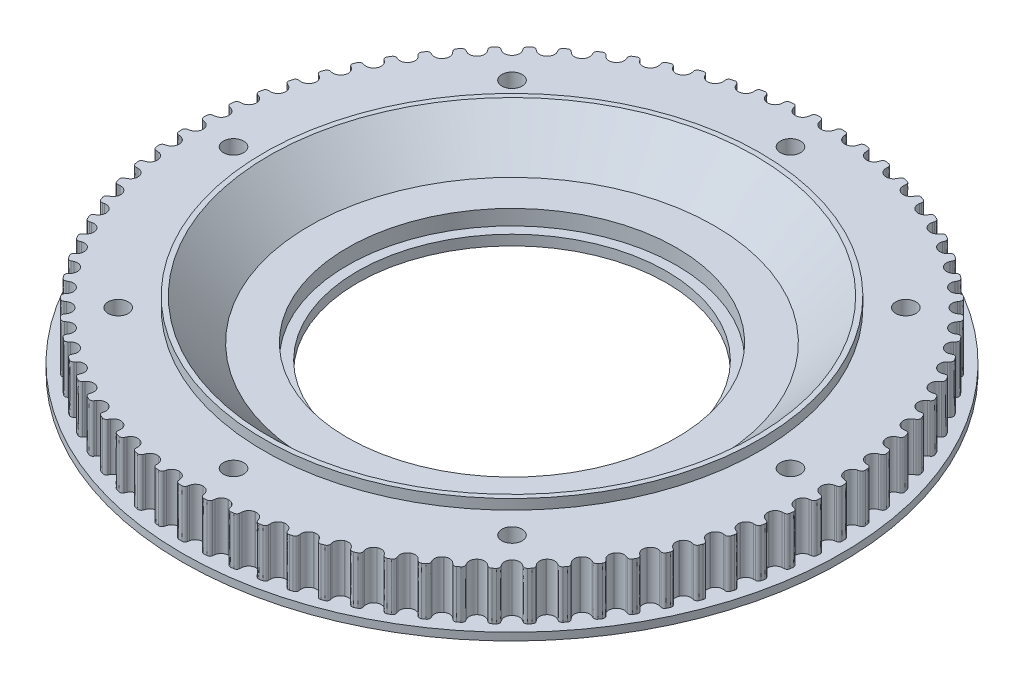
from build123d import *

# Parameters (mm, degrees)
CUT_EXTRUDE1_DEPTH = 9.5
SKETCH3_R          = 2.000000000000003
SKETCH3_R_2        = 2.0000000000000036
SKETCH3_R_3        = 2.0000000000000018
SKETCH3_R_4        = 1.9999999999999967
CUT_EXTRUDE2_DEPTH = 5
SKETCH4_R          = 5.000000000000004
SKETCH4_R_2        = 5.000000000000005
CUT_EXTRUDE3_DEPTH = 6


with BuildPart() as part:
    # Sketch1 → Revolve1 (revolve)
    with BuildSketch(Plane.XY):
        Polygon((32.49999999999997, 5.000000000000004), (40.000000000000036, 5.000000000000004), (47.99999999999993, 12.999999999999956), (48.99999999999993, 12.999999999999956), (48.99999999999993, 11.00000000000001), (63.08999999999942, 11.00000000000001), (63.08999999999942, 1.5000000000000013), (65.08999999999942, 1.5000000000000013), (65.08999999999942, 0), (30.49999999999997, 0), (30.49999999999997, 2.0000000000000018), (32.49999999999997, 2.0000000000000018), align=None)
    revolve(axis=Axis((0, 0, 0), (0, 1, 0)))

    # Sketch2 → Cut-Extrude1 (cut)
    with BuildSketch(Plane(origin=(0, 11.00000000000001, 0), x_dir=(1, 0, 0), z_dir=(0, 1, 0))):
        with BuildLine():
            Line((52.05039343045466, -31.865623639455784), (52.022866904803024, -31.91054239869714))
            ThreePointArc((52.022866904803024, -31.91054239869714), (51.81882375148763, -32.8704908547109), (52.26436888287487, -33.74491877198895))
            Line((52.26436888287487, -33.74491877198895), (52.543032914400065, -34.009359777000086))
            add(Edge.make_bspline(
                [(52.543032914400065, -34.00935977700007), (52.587234547554715, -34.05139102952213), (52.624925427816784, -34.09929538927096), (52.686452012839446, -34.20944583186515), (52.70992184584953, -34.27136455630442), (52.73543775007826, -34.40739833239602), (52.73752196718395, -34.48181270323129), (52.709509501328654, -34.637673444533), (52.67908552725793, -34.71698912006967), (52.63202005071728, -34.78819577645396)],
                knots=[0, 0, 0, 0, 0.25, 0.25, 0.5, 0.5, 0.75, 0.75, 1, 1, 1, 1], degree=3))
            ThreePointArc((52.63202005071727, -34.78819577645396), (53.79306796909941, -32.964434447929555), (54.89094648668928, -31.101962860813266))
            add(Edge.make_bspline(
                [(54.8909464866893, -31.10196286081327), (54.848830402237766, -31.176292309096397), (54.791918509425116, -31.239308669383263), (54.66695275672828, -31.334328906573358), (54.59938943407146, -31.366677308943512), (54.3997567713713, -31.42557924642052), (54.271111105218516, -31.4166793267191), (54.15659770370004, -31.3762575388)],
                knots=[0, 0, 0, 0, 0.2500000000000041, 0.2500000000000041, 0.5000000000000081, 0.5000000000000081, 1, 1, 1, 1], degree=3))
            Line((54.156597703700044, -31.376257538799994), (53.794469684400134, -31.24802000819996))
            ThreePointArc((53.794469684400134, -31.24802000819996), (52.813079325966775, -31.248017567255395), (52.05039343045466, -31.865623639455784))
        make_face()
        with BuildLine():
            ThreePointArc((49.740322715325696, -38.81041607835773), (51.04088217511512, -37.083371567132474), (52.28150413617771, -35.312779914059824))
            add(Edge.make_bspline(
                [(52.28150413617773, -35.3127799140598), (52.23368606026181, -35.38357583955579), (52.17200540117707, -35.44193268578829), (52.03996967430465, -35.52685530734518), (51.97007660042527, -35.55380303318634), (51.766437945849205, -35.59686039745431), (51.63888713100357, -35.57789449059966), (51.52789875869999, -35.52861139180001)],
                knots=[0, 0, 0, 0, 0.25, 0.25, 0.5, 0.5, 1, 1, 1, 1], degree=3))
            Line((51.527898758700005, -35.528611391800005), (51.17694661019997, -35.37235781549993))
            ThreePointArc((51.17694661019997, -35.37235781549993), (50.198552850097904, -35.295364918002896), (49.38975545147544, -35.85126870828785))
            Line((49.38975545147544, -35.85126870828785), (49.35882613070219, -35.89384257789811))
            ThreePointArc((49.35882613070219, -35.89384257789811), (49.08009554046986, -36.83481885506012), (49.45565558398058, -37.74150609431695))
            Line((49.45565558398058, -37.74150609431695), (49.712713807899846, -38.02699968220031))
            add(Edge.make_bspline(
                [(49.712713807899846, -38.026999682200305), (49.75348430509614, -38.072368824481615), (49.78730046420604, -38.12308270345964), (49.83999507918009, -38.23772090922422), (49.85853447539988, -38.301290180775155), (49.873298635550775, -38.43890656490655), (49.86953794346592, -38.513255066860424), (49.82938313787229, -38.66643750877256), (49.79282991458032, -38.74312164305776), (49.74032271532568, -38.810416078357726)],
                knots=[0, 0, 0, 0, 0.25, 0.25, 0.5, 0.5, 0.75, 0.75, 1, 1, 1, 1], degree=3))
        make_face()
        with BuildLine():
            add(Edge.make_bspline(
                [(55.049404501899964, -29.782041907300062), (55.09676700199772, -29.820475085628452), (55.13810022660204, -29.86527457984128), (55.208079449816296, -29.970258145157917), (55.236335020291996, -30.03014457295876), (55.27244535456429, -30.163757047544998), (55.28036163096904, -30.237778497920328), (55.26466421101942, -30.395356605312852), (55.24055706008681, -30.476814814585858), (55.1992234805736, -30.551494679339157)],
                knots=[0, 0, 0, 0, 0.25, 0.25, 0.5, 0.5, 0.75, 0.75, 1, 1, 1, 1], degree=3))
            ThreePointArc((55.199223480573586, -30.551494679339147), (56.21360161104403, -28.6422606285681), (57.16196789901859, -26.699391864077384))
            add(Edge.make_bspline(
                [(57.16196789901863, -26.69939186407738), (57.12581346569756, -26.77679656938197), (57.07402121990113, -26.844083926906947), (56.956895896800184, -26.94861594837083), (56.89207887571722, -26.986165588612046), (56.697683006643224, -27.06054894926683), (56.5687356324943, -27.061769887682637), (56.45140632989997, -27.03045681120006)],
                knots=[0, 0, 0, 0, 0.2500000000000032, 0.2500000000000032, 0.5000000000000064, 0.5000000000000064, 1, 1, 1, 1], degree=3))
            Line((56.451406329899974, -27.030456811200057), (56.08033016329991, -26.93102881310002))
            ThreePointArc((56.08033016329991, -26.93102881310002), (55.10194026795548, -27.00803630576218), (54.39006241210571, -27.68361521276635))
            Line((54.39006241210571, -27.68361521276635), (54.366171360011045, -27.730507776186478))
            ThreePointArc((54.366171360011045, -27.730507776186478), (54.2380742288242, -28.703507074894212), (54.75085418316273, -29.540282569715025))
            Line((54.75085418316273, -29.540282569715025), (55.049404501899964, -29.782041907300073))
        make_face()
        with BuildLine():
            ThreePointArc((46.541959750058496, -42.593357259365334), (47.9740123697056, -40.97367736915163), (49.34972892730212, -39.30588193644552))
            add(Edge.make_bspline(
                [(49.34972892730212, -39.305881936445495), (49.29650367426119, -39.37270785873167), (49.230434530678615, -39.42604540154706), (49.09214287379333, -39.50034683126934), (49.020350962733566, -39.5217277388906), (48.81396181630379, -39.54867506698108), (48.6882922459539, -39.51976010409543), (48.581514507600026, -39.46192190050033)],
                knots=[0, 0, 0, 0, 0.2499999999999836, 0.2499999999999836, 0.4999999999999671, 0.4999999999999671, 1, 1, 1, 1], degree=3))
            Line((48.58151450760004, -39.46192190050032), (48.243902623700016, -39.27861526610013))
            ThreePointArc((48.243902623700016, -39.27861526610013), (47.274589121585194, -39.12509083332004), (46.42467640517837, -39.615791140363484))
            Line((46.42467640517837, -39.615791140363484), (46.39047011741182, -39.65584188699138))
            ThreePointArc((46.39047011741182, -39.65584188699138), (46.03877001827446, -40.57205443647881), (46.34204162731156, -41.5054164920197))
            Line((46.34204162731156, -41.5054164920197), (46.57590389249995, -41.81018844249998))
            add(Edge.make_bspline(
                [(46.57590389249995, -41.81018844249997), (46.612987287184744, -41.85861780529146), (46.642720237275725, -41.911828535570265), (46.68625800237796, -42.03024772184557), (46.69975266026444, -42.09507561480993), (46.70367405038063, -42.23342615621093), (46.69409163502221, -42.307250406046016), (46.64204205741928, -42.45681012787553), (46.5995849476832, -42.53038993772132), (46.541959750058446, -42.59335725936527)],
                knots=[0, 0, 0, 0, 0.25, 0.25, 0.5, 0.5, 0.75, 0.75, 1, 1, 1, 1], degree=3))
        make_face()
        with BuildLine():
            add(Edge.make_bspline(
                [(57.216376066200084, -25.371106341500276), (57.2666095663394, -25.405705996518012), (57.31133030221146, -25.44712442141508), (57.389330718436156, -25.546293850863076), (57.422197821389524, -25.60377876228445), (57.46867995348635, -25.734146170029383), (57.48237948271381, -25.80731833308843), (57.47909388848367, -25.965642285138948), (57.461452189291286, -26.04874081120076), (57.42610534206745, -26.126433458123742)],
                knots=[0, 0, 0, 0, 0.25, 0.25, 0.5, 0.5, 0.75, 0.75, 1, 1, 1, 1], degree=3))
            ThreePointArc((57.42610534206742, -26.126433458123774), (58.28755970613694, -24.14349774791374), (59.08056677096715, -22.13221023805092))
            add(Edge.make_bspline(
                [(59.08056677096722, -22.132210238050934), (59.05059689288043, -22.212212974628976), (59.00424361051852, -22.283356480457737), (58.89568083357891, -22.39675581152231), (58.834009732558506, -22.439275183616246), (58.646049172286816, -22.52868136929511), (58.51759509358216, -22.540015638338012), (58.39816853409989, -22.518005222100346)],
                knots=[0, 0, 0, 0, 0.2499999999999991, 0.2499999999999991, 0.4999999999999982, 0.4999999999999982, 1, 1, 1, 1], degree=3))
            Line((58.398168534099895, -22.518005222100342), (58.02043527369998, -22.447995841499974))
            ThreePointArc((58.02043527369998, -22.44799584149997), (57.05112293896299, -22.601521667028305), (56.39444431346011, -23.33084310794794))
            Line((56.39444431346011, -23.33084310794794), (56.37428909540439, -23.379502817993576))
            ThreePointArc((56.37428909540439, -23.379502817993576), (56.32292727878846, -24.359552930343266), (56.89977882707432, -25.15351675203978))
            Line((56.89977882707432, -25.15351675203978), (57.21637606620009, -25.371106341500294))
        make_face()
        with BuildLine():
            ThreePointArc((43.05665012616038, -46.11369622914008), (44.611366825059164, -44.611366825059335), (46.113696229139904, -43.056650126160555))
            add(Edge.make_bspline(
                [(46.113696229139855, -43.056650126160505), (46.05539195035789, -43.119094041204775), (45.98534166051779, -43.16708343691514), (45.84164668767108, -43.23030558178013), (45.76839856043599, -43.24598785077658), (45.560531379871456, -43.25665900345073), (45.43751784870796, -43.2179732548952), (45.335605740599924, -43.15193742510017)],
                knots=[0, 0, 0, 0, 0.2499999999999958, 0.2499999999999958, 0.4999999999999916, 0.4999999999999916, 1, 1, 1, 1], degree=3))
            Line((45.33560574059994, -43.15193742510017), (45.01341655850002, -42.94270277019992))
            ThreePointArc((45.01341655850002, -42.94270277019992), (44.05914122202771, -42.713602867894394), (43.173352385124396, -43.13610295008752))
            Line((43.173352385124396, -43.13610295008752), (43.13610494143315, -43.17335039377876))
            ThreePointArc((43.13610494143315, -43.17335039377876), (42.71360245123688, -44.05914518702008), (42.94270864691114, -45.013425607577446))
            Line((42.94270864691114, -45.013425607577446), (43.15193742519993, -45.33560574060014))
            add(Edge.make_bspline(
                [(43.15193742519994, -45.33560574060012), (43.1851057022567, -45.386794487928924), (43.21057212980475, -45.44217400766157), (43.24468462023505, -45.56364408078617), (43.25305134073497, -45.629330909646825), (43.24610578414227, -45.76756263122322), (43.230760724287734, -45.84040747788959), (43.167137277629955, -45.985422394217935), (43.119038043649525, -46.055444235628784), (43.05665012616043, -46.11369622914011)],
                knots=[0, 0, 0, 0, 0.25, 0.25, 0.5, 0.5, 0.75, 0.75, 1, 1, 1, 1], degree=3))
        make_face()
        with BuildLine():
            add(Edge.make_bspline(
                [(59.03059244160002, -20.803751424000033), (59.08338443962468, -20.834302281684405), (59.13121696855683, -20.872084278903973), (59.21675767928754, -20.964828159973436), (59.25403367809954, -21.01955714142065), (59.31060103022011, -21.14587572390338), (59.32999935011685, -21.21774746892839), (59.339145838387196, -21.375841145825277), (59.32807835787701, -21.46006765862972), (59.29893616800966, -21.54029408671844)],
                knots=[0, 0, 0, 0, 0.25, 0.25, 0.5, 0.5, 0.75, 0.75, 1, 1, 1, 1], degree=3))
            ThreePointArc((59.2989361680096, -21.540294086718458), (60.00215561306112, -19.495882175115643), (60.634914302490714, -17.428576176199872))
            add(Edge.make_bspline(
                [(60.634914302490714, -17.42857617619987), (60.6113137539032, -17.510683700577406), (60.57068521837536, -17.585244731338655), (60.471354313217475, -17.706812227419025), (60.41320935510541, -17.754039185297632), (60.232842942993166, -17.85791697713508), (60.10567412184356, -17.87929469726663), (59.98488888149991, -17.866723239399967)],
                knots=[0, 0, 0, 0, 0.2499999999999883, 0.2499999999999883, 0.4999999999999767, 0.4999999999999767, 1, 1, 1, 1], degree=3))
            Line((59.98488888149993, -17.866723239399956), (59.602826833800066, -17.826566472699962))
            ThreePointArc((59.602826833800066, -17.826566472699962), (58.648528751447, -18.055681732642537), (58.051100510838744, -18.83430752828831))
            Line((58.051100510838744, -18.83430752828831), (58.034840971300056, -18.8843552023004))
            ThreePointArc((58.034840971300056, -18.8843552023004), (58.06053065316694, -19.865411221413463), (58.69789392246156, -20.611667836356652))
            Line((58.69789392246156, -20.61166783635665), (59.03059244160003, -20.803751424000048))
        make_face()
        with BuildLine():
            ThreePointArc((39.305881936444884, -49.34972892730263), (40.9736773691511, -47.97401236970605), (42.59335725936482, -46.541959750058965))
            add(Edge.make_bspline(
                [(42.59335725936485, -46.54195975005901), (42.53033342010935, -46.59963667035979), (42.456733867342486, -46.64198204838247), (42.30852150582519, -46.69373512284388), (42.234268761476606, -46.70362206681236), (42.026205117068436, -46.69795125286554), (41.90660604441697, -46.64973322914507), (41.810188442499935, -46.57590389250023)],
                knots=[0, 0, 0, 0, 0.2500000000000159, 0.2500000000000159, 0.5000000000000319, 0.5000000000000319, 1, 1, 1, 1], degree=3))
            Line((41.81018844249994, -46.57590389250023), (41.50541126730011, -46.34203761820023))
            ThreePointArc((41.50541126730011, -46.34203761820023), (40.57205452159383, -46.03877001599833), (39.65584702422362, -46.390465729738665))
            Line((39.65584702422362, -46.390465729738665), (39.61578756571946, -46.42467945818964))
            ThreePointArc((39.61578756571946, -46.42467945818964), (39.125091141720766, -47.274587457676844), (39.278611408089375, -48.24389551806403))
            Line((39.278611408089375, -48.24389551806403), (39.46192190050012, -48.58151450750033))
            add(Edge.make_bspline(
                [(39.46192190050013, -48.58151450750032), (39.490973580169495, -48.635146489907385), (39.512016476180634, -48.69235336593966), (39.53649337709197, -48.81612542251945), (39.53968057659108, -48.882266206133174), (39.52191089495595, -49.019526863354926), (39.50089779800174, -49.09094319414955), (39.426092741994616, -49.230519239795306), (39.37264793154166, -49.29655140483465), (39.30588193644496, -49.34972892730272)],
                knots=[0, 0, 0, 0, 0.25, 0.25, 0.5, 0.5, 0.75, 0.75, 1, 1, 1, 1], degree=3))
        make_face()
        with BuildLine():
            add(Edge.make_bspline(
                [(60.4808628559, -16.108132898800207), (60.53589060062079, -16.1344481651758), (60.586540019166364, -16.16836079614038), (60.679093637476825, -16.254107331964388), (60.72054871321922, -16.305742961067594), (60.7868525288265, -16.42723392222205), (60.81183004229991, -16.497362136005417), (60.83335222192903, -16.654250837658733), (60.82892719479843, -16.73908605274663), (60.80616933357889, -16.821351639393438)],
                knots=[0, 0, 0, 0, 0.25, 0.25, 0.5, 0.5, 0.75, 0.75, 1, 1, 1, 1], degree=3))
            ThreePointArc((60.806169333578886, -16.82135163939346), (61.34681827788927, -14.728068005669485), (61.815427424184165, -12.617489146633512))
            add(Edge.make_bspline(
                [(61.81542742418424, -12.617489146633508), (61.79834171032621, -12.701195238618263), (61.76368841006407, -12.77871410076338), (61.67420178474939, -12.907700257821062), (61.61994145254725, -12.959343631584455), (61.44828120750303, -13.077052588450899), (61.32318168197914, -13.108341958918153), (61.201784759800134, -13.105285354000026)],
                knots=[0, 0, 0, 0, 0.25, 0.25, 0.5, 0.5, 1, 1, 1, 1], degree=3))
            Line((61.201784759800134, -13.105285354000026), (60.81774830820001, -13.095228932800193))
            ThreePointArc((60.81774830820001, -13.095228932800191), (59.88438970004374, -13.398494275027726), (59.349884157167814, -14.221556838780145))
            Line((59.349884157167814, -14.221556838780145), (59.33758616450062, -14.272781088998512))
            ThreePointArc((59.33758616450062, -14.272781088998512), (59.4401702174952, -15.24879570131368), (60.1341182411436, -15.942743935590569))
            Line((60.1341182411436, -15.942743935590569), (60.480862855900014, -16.108132898800232))
        make_face()
        with BuildLine():
            ThreePointArc((35.31277991405934, -52.28150413617804), (37.08337156713182, -51.0408821751156), (38.81041607835701, -49.740322715326265))
            add(Edge.make_bspline(
                [(38.810416078357086, -49.74032271532638), (38.74306124155455, -49.792877043490336), (38.66636619157851, -49.82931733048872), (38.514550219884846, -49.86928225963307), (38.4397506512834, -49.873312922275936), (38.23277332458734, -49.85133510416197), (38.117326078501904, -49.793882085426496), (38.0269996822, -49.7127138078001)],
                knots=[0, 0, 0, 0, 0.2500000000000047, 0.2500000000000047, 0.5000000000000093, 0.5000000000000093, 1, 1, 1, 1], degree=3))
            Line((38.02699968220001, -49.7127138078001), (37.74150833490007, -49.45565760140011))
            ThreePointArc((37.74150833490007, -49.45565760140011), (36.8348475551217, -49.08009704545289), (35.89388664108146, -49.35879411938849))
            Line((35.89388664108146, -49.35879411938849), (35.851225257002575, -49.389787018299124))
            ThreePointArc((35.851225257002575, -49.389787018299124), (35.29535833369542, -50.19857741986388), (35.37235666298035, -51.176944021592284))
            Line((35.37235666298035, -51.176944021592284), (35.528611391799934, -51.5278987587003))
            add(Edge.make_bspline(
                [(35.528611391799934, -51.52789875870029), (35.55336647387949, -51.58364664094821), (35.56985610190187, -51.6423281738662), (35.58454650506103, -51.7676391180141), (35.58253453341441, -51.833826076456006), (35.55405028273273, -51.96926941172751), (35.527498701409456, -52.03881692122286), (35.44197323409834, -52.17209356345076), (35.383512352202146, -52.233728941862815), (35.31277991405935, -52.28150413617805)],
                knots=[0, 0, 0, 0, 0.25, 0.25, 0.5, 0.5, 0.75, 0.75, 1, 1, 1, 1], degree=3))
        make_face()
        with BuildLine():
            add(Edge.make_bspline(
                [(61.55825033790026, -11.313203722200413), (61.61517286583816, -11.335119810480622), (61.66832690348864, -11.364953992543642), (61.76732280554472, -11.44317452721545), (61.81270137389042, -11.491398453149966), (61.888332867913086, -11.607312760801024), (61.91873558028692, -11.675265079585133), (61.95250075988045, -11.82998153497766), (61.95474546789339, -11.91490241503725), (61.93851224510364, -11.998699965544123)],
                knots=[0, 0, 0, 0, 0.25, 0.25, 0.5, 0.5, 0.75, 0.75, 1, 1, 1, 1], degree=3))
            ThreePointArc((61.93851224510358, -11.998699965544114), (62.3132574081472, -9.869450399388118), (62.61482788009216, -7.728611100736538))
            add(Edge.make_bspline(
                [(62.61482788009222, -7.728611100736528), (62.60436234007123, -7.813399684437174), (62.57589792419477, -7.893398448403312), (62.49680729352526, -8.029008023888277), (62.446766120224744, -8.08474941496346), (62.28487038474205, -8.215563821997888), (62.16261143501809, -8.256571933427033), (62.04134598380005, -8.263049647200194)],
                knots=[0, 0, 0, 0, 0.25, 0.25, 0.5, 0.5, 1, 1, 1, 1], degree=3))
            Line((62.041345983800056, -8.263049647200189), (61.657708138299945, -8.283155039000107))
            ThreePointArc((61.657708138299945, -8.283155039000105), (60.75102048887668, -8.658717631273188), (60.282740778235826, -9.521181466418579))
            Line((60.282740778235826, -9.521181466418579), (60.27450039990054, -9.573209099498927))
            ThreePointArc((60.27450039990054, -9.573209099498927), (60.453344569870694, -10.538166960679733), (61.1995998608331, -11.175530241468298))
            Line((61.1995998608331, -11.175530241468298), (61.55825033790026, -11.313203722200413))
        make_face()
        with BuildLine():
            ThreePointArc((31.101962860812755, -54.89094648668957), (32.96443444792896, -53.79306796909977), (34.78819577645338, -52.63202005071766))
            add(Edge.make_bspline(
                [(34.78819577645342, -52.63202005071764), (34.7169252070707, -52.679127771836406), (34.63760751037215, -52.709438301323395), (34.48312392445174, -52.73736868807282), (34.40823869581111, -52.735518219014224), (34.203623770873506, -52.6973688972903), (34.09304012201575, -52.6310351005054), (34.00935977700004, -52.54303291440007)],
                knots=[0, 0, 0, 0, 0.2500000000000075, 0.2500000000000075, 0.5000000000000151, 0.5000000000000151, 1, 1, 1, 1], degree=3))
            Line((34.00935977700005, -52.54303291440007), (33.74491631990008, -52.26436629890027))
            ThreePointArc((33.74491631990008, -52.26436629890027), (32.87048625554468, -51.818823145947704), (31.91053752545482, -52.02286989105868))
            Line((31.91053752545482, -52.02286989105868), (31.86563029890134, -52.05038934949975))
            ThreePointArc((31.86563029890134, -52.05038934949975), (31.248018554451438, -52.81307653815337), (31.24802064094608, -53.79447147120247))
            Line((31.24802064094608, -53.79447147120247), (31.376257538800008, -54.15659770370027))
            add(Edge.make_bspline(
                [(31.376257538800008, -54.156597703700264), (31.396561040583958, -54.2141164571449), (31.40839573657783, -54.27391085578436), (31.413209070763948, -54.399988103859414), (31.40601033244639, -54.46581317252118), (31.36698712759533, -54.59860413264092), (31.33506076123104, -54.665854037314155), (31.239342175562363, -54.79200958130601), (31.176225652999392, -54.8488681704871), (31.101962860812808, -54.89094648668961)],
                knots=[0, 0, 0, 0, 0.2499999999999986, 0.2499999999999986, 0.4999999999999971, 0.4999999999999971, 0.7499999999999957, 0.7499999999999957, 1, 1, 1, 1], degree=3))
        make_face()
        with BuildLine():
            add(Edge.make_bspline(
                [(62.25610896949993, -6.448524072800384), (62.31457710121344, -6.465906672844076), (62.36990804565176, -6.49147846835196), (62.47473588879757, -6.561690746264056), (62.52375817578235, -6.60620565249109), (62.60825105491038, -6.715828656386754), (62.64389152335267, -6.781186131529001), (62.68969152935019, -6.9327764622662515), (62.69859213313541, -7.017259441832287), (62.68898363199168, -7.102072316435612)],
                knots=[0, 0, 0, 0, 0.25, 0.25, 0.5, 0.5, 0.75, 0.75, 1, 1, 1, 1], degree=3))
            ThreePointArc((62.68898363199162, -7.102072316435608), (62.895514585222976, -4.949984349470001), (63.02818710057616, -2.792083597380036))
            add(Edge.make_bspline(
                [(63.028187100576254, -2.7920835973800373), (63.02440625792709, -2.8774319229824044), (63.00230621902528, -2.9594173697878303), (62.93409920303955, -3.10081428557171), (62.888585709114125, -3.160310029747491), (62.73745262423816, -3.303423372630259), (62.61878801739475, -3.3538973963772856), (62.498405575800014, -3.3698689658003387)],
                knots=[0, 0, 0, 0, 0.2499999999999998, 0.2499999999999998, 0.4999999999999996, 0.4999999999999996, 1, 1, 1, 1], degree=3))
            Line((62.49840557580003, -3.3698689658003254), (62.11752817039998, -3.420012770200097))
            ThreePointArc((62.11752817039998, -3.4200127702000938), (61.243084081538036, -3.8655703886833948), (60.843926214369326, -4.762145568471141))
            Line((60.843926214369326, -4.762145568471141), (60.83979830150055, -4.814615473199203))
            ThreePointArc((60.83979830150055, -4.814615473199203), (61.09380146822761, -5.762568128113736), (61.88776520635972, -6.339415965240809))
            Line((61.88776520635972, -6.339415965240809), (62.25610896949993, -6.448524072800384))
        make_face()
        with BuildLine():
            ThreePointArc((26.699391864077107, -57.16196789901873), (28.642260628567925, -56.21360161104412), (30.551494679339072, -55.19922348057362))
            add(Edge.make_bspline(
                [(30.551494679339125, -55.19922348057368), (30.476747784136457, -55.24059415988137), (30.39529646069153, -55.264588057363376), (30.239097703222363, -55.28031170159555), (30.164588506878793, -55.27259150959322), (29.9635975027529, -55.21850588751308), (29.85855923609117, -55.143700282594374), (29.782041907300044, -55.04940450190016)],
                knots=[0, 0, 0, 0, 0.2499999999999969, 0.2499999999999969, 0.4999999999999938, 0.4999999999999938, 1, 1, 1, 1], degree=3))
            Line((29.782041907300044, -55.04940450190016), (29.540278017600055, -54.750848561500035))
            ThreePointArc((29.540278017600055, -54.750848561500035), (28.70352699889216, -54.238078464393034), (27.730550520010777, -54.36614958268058))
            Line((27.730550520010777, -54.36614958268058), (27.683572843723823, -54.390083998493736))
            ThreePointArc((27.683572843723823, -54.390083998493736), (27.008028370852596, -55.10195808862251), (26.931026603952034, -56.080321918144904))
            Line((26.931026603952034, -56.080321918144904), (27.030456811200057, -56.45140632990027))
            add(Edge.make_bspline(
                [(27.03045681120006, -56.451406329900266), (27.046185368057586, -56.51033821735995), (27.053292167186576, -56.57087682936956), (27.04819875659394, -56.69694307321287), (27.03585763422066, -56.76200041865698), (26.98653606623514, -56.89132030319861), (26.949431751494995, -56.955857985024245), (26.844110184378692, -57.07411463990048), (26.77672715549918, -57.12584588774103), (26.699391864077107, -57.16196789901874)],
                knots=[0, 0, 0, 0, 0.25, 0.25, 0.5, 0.5, 0.75, 0.75, 1, 1, 1, 1], degree=3))
        make_face()
        with BuildLine():
            add(Edge.make_bspline(
                [(62.57013976580014, -1.5440875432000052), (62.629791247060446, -1.556829070437298), (62.686957964614294, -1.5779808207671497), (62.796971450338326, -1.6397519598781396), (62.84933521726174, -1.6802833971987747), (62.942168554797924, -1.782939235065892), (62.982827043969266, -1.8452989159991584), (63.04037950410421, -1.9928285172823288), (63.05588112847944, -2.07635273069262), (63.052956588586184, -2.1616580298168806)],
                knots=[0, 0, 0, 0, 0.2499999999999999, 0.2499999999999999, 0.4999999999999998, 0.4999999999999998, 0.7499999999999997, 0.7499999999999997, 1, 1, 1, 1], degree=3))
            ThreePointArc((63.05295658858609, -2.161658029816878), (63.089999999999954, 1.78e-15), (63.052956588586085, 2.1616580298168815))
            add(Edge.make_bspline(
                [(63.052956588586135, 2.161658029816883), (63.05588375346087, 2.076276163120395), (63.04028434562292, 1.992809501018212), (62.98338146325566, 1.8464970039409065), (62.94267625453048, 1.7836137177119773), (62.80323760598597, 1.6290837803295102), (62.68889894878382, 1.5694550334046835), (62.57013976580016, 1.5440875430999994)],
                knots=[0, 0, 0, 0, 0.2500000000000004, 0.2500000000000004, 0.5000000000000003, 0.5000000000000003, 1, 1, 1, 1], degree=3))
            Line((62.57013976580016, 1.5440875430999994), (62.19436973339997, 1.4642148743997012))
            ThreePointArc((62.19436973339997, 1.4642148743996992), (61.35759571465638, 0.9514387783859345), (61.03000044830006, 0.02633801384817094))
            Line((61.03000044830006, 0.02633801384817076), (61.03000044830006, -0.0263379370002868))
            ThreePointArc((61.03000044830006, -0.0263379370002868), (61.35759552779277, -0.9514385476287832), (62.19436922768751, -1.4642147669072454))
            Line((62.19436922768751, -1.464214766907247), (62.57013976580014, -1.5440875432000114))
        make_face()
        with BuildLine():
            ThreePointArc((22.132210238050632, -59.08056677096726), (24.143497747913404, -58.287559706137074), (26.126433458123444, -57.42610534206758))
            add(Edge.make_bspline(
                [(26.126433458123476, -57.42610534206757), (26.04867107656604, -57.461483915569254), (25.96558830086858, -57.479013250689626), (25.808637389132414, -57.482433210909264), (25.734963599058343, -57.468890893513596), (25.538835692121218, -57.39920242692318), (25.43999040349808, -57.31638621530006), (25.371106341500052, -57.21637606620012)],
                knots=[0, 0, 0, 0, 0.2499999999999994, 0.2499999999999994, 0.4999999999999989, 0.4999999999999989, 1, 1, 1, 1], degree=3))
            Line((25.371106341500063, -57.21637606620012), (25.153513997799948, -56.89977481960019))
            ThreePointArc((25.153513997799948, -56.89977481960019), (24.35955465538595, -56.32292778978403), (23.379510634902022, -56.374285857581484))
            Line((23.379510634902022, -56.374285857581484), (23.330837488204327, -56.394446641199366))
            ThreePointArc((23.330837488204327, -56.394446641199366), (22.601519363770766, -57.05112718101016), (22.4479964923161, -58.02043878515703))
            Line((22.447996492316097, -58.02043878515703), (22.51800522210009, -58.398168534100265))
            add(Edge.make_bspline(
                [(22.5180052221001, -58.39816853410024), (22.529060968968423, -58.45815495087075), (22.531396055452152, -58.51906453557653), (22.51642730265088, -58.644342534873005), (22.499019883345447, -58.70823105693125), (22.43970403609293, -58.83328256580305), (22.39765053341579, -58.8947101285121), (22.283375327335925, -59.00433880267062), (22.212141230920402, -59.0506237688255), (22.132210238050664, -59.080566770967316)],
                knots=[0, 0, 0, 0, 0.25, 0.25, 0.5, 0.5, 0.75, 0.75, 1, 1, 1, 1], degree=3))
        make_face()
        with BuildLine():
            add(Edge.make_bspline(
                [(62.4984055758, 3.3698689657999106), (62.55887190335027, 3.3618469008869987), (62.61752194219658, 3.345245603309132), (62.73204280077603, 3.292296442612967), (62.78742520760239, 3.255998363988967), (62.88802665515046, 3.1609425995261056), (62.93345249194465, 3.101965180971951), (63.00240257616196, 2.959405878193159), (63.02440964845849, 2.8773553854885003), (63.028187100576226, 2.792083597379591)],
                knots=[0, 0, 0, 0, 0.25, 0.25, 0.5, 0.5, 0.75, 0.75, 1, 1, 1, 1], degree=3))
            ThreePointArc((63.02818710057618, 2.792083597379589), (62.89551458522301, 4.949984349469582), (62.68898363199167, 7.102072316435164))
            add(Edge.make_bspline(
                [(62.68898363199174, 7.102072316435172), (62.69860075744596, 7.017183316245327), (62.68959815620814, 6.932750038574355), (62.64435023265129, 6.782424025400782), (62.60870427027365, 6.716540893489331), (62.48181974369749, 6.551547090057736), (62.37251197198022, 6.4831312510092), (62.256108969499934, 6.448524072799958)],
                knots=[0, 0, 0, 0, 0.2499999999999974, 0.2499999999999974, 0.4999999999999949, 0.4999999999999949, 1, 1, 1, 1], degree=3))
            Line((62.25610896949994, 6.448524072799965), (61.88776344060007, 6.339415442199921))
            ThreePointArc((61.88776344060007, 6.339415442199921), (61.093813322743955, 5.762585376279901), (60.83979487347806, 4.814659038410981))
            Line((60.83979487347806, 4.814659038410981), (60.843929647752475, 4.762101918348869))
            ThreePointArc((60.843929647752475, 4.762101918348869), (61.24309746182373, 3.865556287391985), (62.11752330608988, 3.42001341060263))
            Line((62.11752330608988, 3.4200134106026314), (62.4984055758, 3.3698689657999106))
        make_face()
        with BuildLine():
            ThreePointArc((17.428576176199847, -60.63491430249072), (19.495882175115355, -60.00215561306121), (21.54029408671785, -59.29893616800981))
            add(Edge.make_bspline(
                [(21.540294086717854, -59.29893616800987), (21.45999564974675, -59.32810451503512), (21.375793654737173, -59.339061213613576), (21.219058243295606, -59.33015640462867), (21.14667408290592, -59.31087545473015), (20.956618466922627, -59.226013796199815), (20.864575570411944, -59.135697567356104), (20.803751423999966, -59.03059244160023)],
                knots=[0, 0, 0, 0, 0.2499999999999903, 0.2499999999999903, 0.4999999999999806, 0.4999999999999806, 1, 1, 1, 1], degree=3))
            Line((20.803751423999984, -59.030592441600234), (20.61166800560005, -58.697894215600165))
            ThreePointArc((20.61166800560005, -58.697894215600165), (19.865435539131614, -58.060539988670584), (18.88440442704857, -58.034824979013386))
            Line((18.88440442704857, -58.034824979013386), (18.834257498400454, -58.051116764600195))
            ThreePointArc((18.834257498400454, -58.051116764600195), (18.05566710493234, -58.64855127464338), (17.826566588646717, -59.60282793684834))
            Line((17.826566588646717, -59.60282793684834), (17.86672323949997, -59.98488888150016))
            add(Edge.make_bspline(
                [(17.866723239499976, -59.98488888150015), (17.873037417332366, -60.04555771980018), (17.870586394586702, -60.10646274935787), (17.845834586915235, -60.23018012358304), (17.82346819320576, -60.292505928272), (17.754523768609413, -60.41251807733806), (17.707780351823438, -60.47045679957934), (17.5852560514263, -60.57078159578948), (17.510610069366304, -60.61133491805026), (17.428576176199858, -60.63491430249073)],
                knots=[0, 0, 0, 0, 0.25, 0.25, 0.5, 0.5, 0.75, 0.75, 1, 1, 1, 1], degree=3))
        make_face()
        with BuildLine():
            add(Edge.make_bspline(
                [(62.04134598380005, 8.263049647199765), (62.10225631142061, 8.25979596813975), (62.16202807456648, 8.247847475834071), (62.280350246825854, 8.204046742735505), (62.33840984260062, 8.172205812532862), (62.446159158783246, 8.08533617187229), (62.496072277810924, 8.030104631094213), (62.57599488591312, 7.8933945523271785), (62.6043717252118, 7.813323648900691), (62.614827880092285, 7.728611100736079)],
                knots=[0, 0, 0, 0, 0.2499999999999976, 0.2499999999999976, 0.4999999999999952, 0.4999999999999952, 0.7499999999999929, 0.7499999999999929, 1, 1, 1, 1], degree=3))
            ThreePointArc((62.614827880092214, 7.72861110073607), (62.313257408147216, 9.869450399388006), (61.93851224510353, 11.998699965544354))
            add(Edge.make_bspline(
                [(61.9385122451036, 11.998699965544368), (61.954760038361194, 11.914827200776024), (61.952409747753684, 11.829947866769109), (61.919095751502475, 11.676535147360001), (61.88872880468424, 11.608058361181985), (61.77518068537572, 11.433617933365452), (61.67157771790422, 11.356836808591181), (61.558250337900056, 11.313203722199887)],
                knots=[0, 0, 0, 0, 0.2499999999999991, 0.2499999999999991, 0.4999999999999982, 0.4999999999999982, 1, 1, 1, 1], degree=3))
            Line((61.55825033790006, 11.313203722199894), (61.19960173969994, 11.17553096259959))
            ThreePointArc((61.19960173969994, 11.17553096259959), (60.453344958719995, 10.53816763406837), (60.274500471434195, 9.573208647850599))
            Line((60.274500471434195, 9.573208647850599), (60.28274074199991, 9.521181695199603))
            ThreePointArc((60.28274074199991, 9.521181695199603), (60.75102093189874, 8.658717232287598), (61.65770956034702, 8.28315496437406))
            Line((61.65770956034702, 8.28315496437406), (62.041345983800056, 8.26304964719976))
        make_face()
        with BuildLine():
            ThreePointArc((12.617489146632936, -61.815427424184286), (14.728068005669021, -61.34681827788938), (16.821351639393217, -60.80616933357895))
            add(Edge.make_bspline(
                [(16.821351639393242, -60.80616933357895), (16.739012213574284, -60.828947621569085), (16.65421013255153, -60.8332641319157), (16.498656547336395, -60.81208945483491), (16.428008289050002, -60.787188745900956), (16.24519672009319, -60.687677095774724), (16.160523690759373, -60.59041767929467), (16.10813289879999, -60.480862855900085)],
                knots=[0, 0, 0, 0, 0.2500000000000039, 0.2500000000000039, 0.5000000000000078, 0.5000000000000078, 1, 1, 1, 1], degree=3))
            Line((16.108132898800008, -60.48086285590009), (15.942744910700167, -60.134120285500074))
            ThreePointArc((15.942744910700169, -60.134120285500074), (15.248794190239623, -59.44016949675679), (14.272775630774273, -59.33758747491905))
            Line((14.272775630774273, -59.33758747491905), (14.221560210000211, -59.34988334780016))
            ThreePointArc((14.221560210000211, -59.34988334780016), (13.398495589528702, -59.88438798694505), (13.095228910507597, -60.817747456889414))
            Line((13.095228910507599, -60.817747456889414), (13.105285354000003, -61.20178475980015))
            add(Edge.make_bspline(
                [(13.105285354000003, -61.20178475980015), (13.106820646630725, -61.26275965821309), (13.099598626025948, -61.32328463286238), (13.0652163666093, -61.44467862326405), (13.038028894750903, -61.50505745127224), (12.959880958114308, -61.61929032572513), (12.908735815927905, -61.673382996009636), (12.778717824268771, -61.763785378540824), (12.7011201738665, -61.79835703219094), (12.617489146632977, -61.81542742418434)],
                knots=[0, 0, 0, 0, 0.25, 0.25, 0.5, 0.5, 0.75, 0.75, 1, 1, 1, 1], degree=3))
        make_face()
        with BuildLine():
            add(Edge.make_bspline(
                [(61.201784759800056, 13.10528535389994), (61.26275965823532, 13.106820646587476), (61.32328463288459, 13.099598625982708), (61.44467862328625, 13.065216366566329), (61.50505745129446, 13.038028894708084), (61.619290325747386, 12.95988095807159), (61.67338299603186, 12.908735815884937), (61.76378537856296, 12.778717824226087), (61.798357032213026, 12.701120173823245), (61.815427424184335, 12.617489146633023)],
                knots=[0, 0, 0, 0, 0.25, 0.25, 0.5, 0.5, 0.75, 0.75, 1, 1, 1, 1], degree=3))
            ThreePointArc((61.81542742418427, 12.61748914663301), (61.34681827788939, 14.72806800566898), (60.806169333579014, 16.821351639393004))
            add(Edge.make_bspline(
                [(60.80616933357902, 16.821351639393008), (60.828947621591354, 16.739012213531176), (60.83326413193798, 16.654210132508492), (60.812089454856945, 16.498656547293642), (60.78718874592325, 16.428008289006804), (60.68767709579669, 16.245196720050387), (60.590417679316886, 16.160523690716637), (60.4808628559, 16.108132898799777)],
                knots=[0, 0, 0, 0, 0.2500000000000021, 0.2500000000000021, 0.5000000000000041, 0.5000000000000041, 1, 1, 1, 1], degree=3))
            Line((60.48086285590001, 16.108132898799784), (60.1341202855001, 15.942744910699723))
            ThreePointArc((60.1341202855001, 15.942744910699725), (59.44016949659078, 15.24879418994265), (59.337587475041055, 14.27277563011814))
            Line((59.337587475041055, 14.27277563011814), (59.34988334778966, 14.221560209997458))
            ThreePointArc((59.34988334778966, 14.221560209997458), (59.884387986787985, 13.398495589640106), (60.817747456508194, 13.095228910497246))
            Line((60.817747456508194, 13.095228910497248), (61.20178475980006, 13.105285353899935))
        make_face()
        with BuildLine():
            ThreePointArc((7.7286111007365115, -62.614827880092164), (9.869450399388201, -62.31325740814719), (11.998699965544363, -61.93851224510353))
            add(Edge.make_bspline(
                [(11.998699965544365, -61.9385122451036), (11.914827200818687, -61.95476003833894), (11.829947866812223, -61.95240974773163), (11.676535147402742, -61.91909575148021), (11.608058361224877, -61.888728804662215), (11.43361793340861, -61.77518068535354), (11.356836808634013, -61.67157771788205), (11.313203722299933, -61.55825033780025)],
                knots=[0, 0, 0, 0, 0.25, 0.25, 0.5, 0.5, 1, 1, 1, 1], degree=3))
            Line((11.313203722299933, -61.55825033780025), (11.175530962700073, -61.19960173970022))
            ThreePointArc((11.175530962700073, -61.19960173970022), (10.538167632983425, -60.45334495795093), (9.573208645185375, -60.27450047175677))
            Line((9.573208645185375, -60.27450047175677), (9.521181695200767, -60.28274074200024))
            ThreePointArc((9.521181695200767, -60.28274074200024), (8.658717232472926, -60.751020931784986), (8.283154964489107, -61.657709559970044))
            Line((8.283154964489105, -61.657709559970044), (8.263049647200134, -62.04134598380005))
            add(Edge.make_bspline(
                [(8.26304964720015, -62.04134598380003), (8.259795968182493, -62.10225631139831), (8.247847475877032, -62.16202807454412), (8.204046742778228, -62.28035024680354), (8.172205812575616, -62.33840984257826), (8.085336171915342, -62.44615915876114), (8.030104631136949, -62.496072277788656), (7.893394552369898, -62.575994885890715), (7.813323648943618, -62.604371725189594), (7.7286111007365195, -62.61482788009215)],
                knots=[0, 0, 0, 0, 0.25, 0.25, 0.5, 0.5, 0.75, 0.75, 1, 1, 1, 1], degree=3))
        make_face()
        with BuildLine():
            add(Edge.make_bspline(
                [(59.98488888149991, 17.866723239399544), (60.045557719822476, 17.8730374172896), (60.10646274938017, 17.87058639454379), (60.23018012360541, 17.84583458687253), (60.29250592829429, 17.82346819316311), (60.412518077360474, 17.754523768566255), (60.470456799601656, 17.70778035178045), (60.57078159581144, 17.585256051383563), (60.61133491807234, 17.510610069323302), (60.63491430249073, 17.428576176199872)],
                knots=[0, 0, 0, 0, 0.25, 0.25, 0.5, 0.5, 0.75, 0.75, 1, 1, 1, 1], degree=3))
            ThreePointArc((60.634914302490714, 17.42857617619987), (60.0021556130612, 19.49588217511541), (59.298936168009774, 21.540294086717946))
            add(Edge.make_bspline(
                [(59.29893616800978, 21.540294086717946), (59.32810451505748, 21.459995649703668), (59.339061213635844, 21.375793654694032), (59.330156404651, 21.21905824325269), (59.3108754547525, 21.14667408286277), (59.22601379622207, 20.95661846687979), (59.135697567378465, 20.864575570369244), (59.030592441600035, 20.803751423900003)],
                knots=[0, 0, 0, 0, 0.2500000000000037, 0.2500000000000037, 0.5000000000000073, 0.5000000000000073, 1, 1, 1, 1], degree=3))
            Line((59.030592441600035, 20.803751423900007), (58.69789421560013, 20.611668005599824))
            ThreePointArc((58.69789421560013, 20.611668005599824), (58.06053998860938, 19.86543554043685), (58.0348249774084, 18.884404429347537))
            Line((58.0348249774084, 18.884404429347537), (58.05111676373331, 18.83425749811838))
            ThreePointArc((58.05111676373331, 18.83425749811838), (58.64855127419235, 18.05566710444167), (59.60282793692095, 17.826566588543862))
            Line((59.60282793692095, 17.826566588543862), (59.98488888149992, 17.866723239399537))
        make_face()
        with BuildLine():
            ThreePointArc((2.792083597379785, -63.028187100576176), (4.949984349469751, -62.895514585223), (7.1020723164353035, -62.688983631991654))
            add(Edge.make_bspline(
                [(7.102072316435338, -62.68898363199164), (7.017183316288535, -62.698600757423684), (6.9327500386172645, -62.689598156185816), (6.782424025444011, -62.644350232629115), (6.71654089353245, -62.608704270251515), (6.5515470901009705, -62.48181974367527), (6.483131251052089, -62.37251197195788), (6.448524072799951, -62.2561089695002)],
                knots=[0, 0, 0, 0, 0.2500000000000031, 0.2500000000000031, 0.5000000000000061, 0.5000000000000061, 1, 1, 1, 1], degree=3))
            Line((6.44852407279996, -62.2561089695002), (6.339415442200085, -61.88776344060006))
            ThreePointArc((6.339415442200087, -61.88776344060006), (5.762585376137404, -61.093813323160425), (4.814659038466108, -60.839794874134824))
            Line((4.814659038466107, -60.839794874134824), (4.762101918508194, -60.843929648401264))
            ThreePointArc((4.762101918508194, -60.843929648401264), (3.8655562877003593, -61.24309746220405), (3.4200134107030973, -62.117523306088884))
            Line((3.420013410703096, -62.117523306088884), (3.3698689658999417, -62.4984055758002))
            add(Edge.make_bspline(
                [(3.3698689658999457, -62.49840557580019), (3.3618469009299745, -62.558871903328026), (3.3452456033521174, -62.617521942174555), (3.29229644265572, -62.73204280075377), (3.255998364031677, -62.787425207580114), (3.1609425995691174, -62.88802665512842), (3.101965181014687, -62.933452491922715), (2.959405878235842, -63.00240257613977), (2.877355385531687, -63.02440964843618), (2.792083597379812, -63.028187100576154)],
                knots=[0, 0, 0, 0, 0.25, 0.25, 0.5, 0.5, 0.75, 0.75, 1, 1, 1, 1], degree=3))
        make_face()
        with BuildLine():
            add(Edge.make_bspline(
                [(58.398168534099945, 22.51800522209984), (58.458154950893, 22.52906096892547), (58.51906453559872, 22.531396055409424), (58.644342534895245, 22.516427302607973), (58.70823105695354, 22.499019883302466), (58.8332825658253, 22.439704036049992), (58.89471012853424, 22.39765053337257), (59.00433880269311, 22.283375327293), (59.05062376884773, 22.21214123087749), (59.08056677096736, 22.13221023805044)],
                knots=[0, 0, 0, 0, 0.25, 0.25, 0.5, 0.5, 0.75, 0.75, 1, 1, 1, 1], degree=3))
            ThreePointArc((59.08056677096734, 22.13221023805043), (58.28755970613717, 24.14349774791317), (57.42610534206769, 26.126433458123177))
            add(Edge.make_bspline(
                [(57.42610534206774, 26.126433458123195), (57.46148391559139, 26.048671076523018), (57.47901325071168, 25.965588300825758), (57.48243321093153, 25.808637389089583), (57.468890893535985, 25.734963599015302), (57.399202426945585, 25.538835692077935), (57.31638621532237, 25.43999040345487), (57.216376066200105, 25.371106341499836)],
                knots=[0, 0, 0, 0, 0.2499999999999986, 0.2499999999999986, 0.4999999999999971, 0.4999999999999971, 1, 1, 1, 1], degree=3))
            Line((57.216376066200105, 25.37110634149985), (56.89977481959995, 25.153513997800015))
            ThreePointArc((56.89977481959995, 25.15351399780002), (56.322927789765416, 24.359554655381558), (56.374285857561595, 23.379510634883136))
            Line((56.374285857561595, 23.379510634883136), (56.394446641177574, 23.330837488190593))
            ThreePointArc((56.394446641177574, 23.330837488190593), (57.051127180999806, 22.60151936375788), (58.02043878515582, 22.44799649231597))
            Line((58.02043878515582, 22.44799649231597), (58.39816853409993, 22.51800522209985))
        make_face()
        with BuildLine():
            ThreePointArc((-2.161658029816968, -63.05295658858609), (-6.762e-14, -63.089999999999954), (2.161658029816833, -63.05295658858609))
            add(Edge.make_bspline(
                [(2.1616580298168233, -63.05295658858608), (2.076276163162968, -63.05588375343856), (1.9928095010613962, -63.04028434560059), (1.8464970039835067, -62.98338146323333), (1.783613717754549, -62.94267625450806), (1.6290837803721763, -62.803237605963595), (1.5694550334475774, -62.688898948761505), (1.544087543199992, -62.57013976570003)],
                knots=[0, 0, 0, 0, 0.2499999999999939, 0.2499999999999939, 0.4999999999999883, 0.4999999999999883, 1, 1, 1, 1], degree=3))
            Line((1.5440875431999985, -62.570139765700056), (1.464214874500089, -62.194369733300135))
            ThreePointArc((1.464214874500089, -62.194369733300135), (0.9514387757076086, -61.35759572050453), (0.02633801360927379, -61.03000045810291))
            Line((0.02633801360927418, -61.03000045810291), (-0.02633793733921447, -61.03000045810291))
            ThreePointArc((-0.02633793733921447, -61.03000045810291), (-0.9514385481130363, -61.35759553771299), (-1.4642147673241248, -62.19436923785563))
            Line((-1.4642147673241246, -62.19436923785563), (-1.5440875434394024, -62.570139775602826))
            add(Edge.make_bspline(
                [(-1.5440875434394017, -62.57013977560281), (-1.5568290707335517, -62.629791256940976), (-1.5779808210639301, -62.68695797449482), (-1.639751960174911, -62.796971460218856), (-1.6802833974949978, -62.84933522714255), (-1.7829392353626339, -62.94216856467859), (-1.8452989162958797, -62.98282705384979), (-1.9928285175790827, -63.04037951398477), (-2.076352730989375, -63.05588113836003), (-2.1616580301564348, -63.05295659848886)],
                knots=[0, 0, 0, 0, 0.2500000000000002, 0.2500000000000002, 0.5000000000000003, 0.5000000000000003, 0.7500000000000004, 0.7500000000000004, 1, 1, 1, 1], degree=3))
        make_face()
        with BuildLine():
            add(Edge.make_bspline(
                [(56.451406329899925, 27.030456811199645), (56.510338217381886, 27.0461853680149), (56.5708768293916, 27.05329216714381), (56.69694307323508, 27.048198756550835), (56.76200041867913, 27.035857634177752), (56.89132030322061, 26.986536066191977), (56.95585798504629, 26.949431751452234), (57.074114639922705, 26.84411018433589), (57.12584588776298, 26.776727155456157), (57.16196789901889, 26.699391864076894)],
                knots=[0, 0, 0, 0, 0.25, 0.25, 0.5, 0.5, 0.75, 0.75, 1, 1, 1, 1], degree=3))
            ThreePointArc((57.16196789901884, 26.699391864076865), (56.21360161104416, 28.64226062856784), (55.199223480573586, 30.551494679339147))
            add(Edge.make_bspline(
                [(55.19922348057358, 30.55149467933914), (55.240594159903544, 30.476747784093693), (55.26458805738541, 30.3952964606483), (55.280311701617606, 30.239097703179603), (55.27259150961548, 30.164588506835997), (55.218505887535386, 29.963597502709924), (55.14370028261637, 29.85855923604823), (55.04940450189997, 29.782041907300037)],
                knots=[0, 0, 0, 0, 0.2500000000000011, 0.2500000000000011, 0.5000000000000022, 0.5000000000000022, 1, 1, 1, 1], degree=3))
            Line((55.04940450189997, 29.782041907300037), (54.75084856160015, 29.54027801749996))
            ThreePointArc((54.75084856160015, 29.54027801749996), (54.23807846377158, 28.70352699811244), (54.36614958259761, 27.730550518337193))
            Line((54.36614958259761, 27.730550518337193), (54.39008399780265, 27.683572843344603))
            ThreePointArc((54.39008399780265, 27.683572843344603), (55.101958088468464, 27.00802837029801), (56.080321918546936, 26.931026603959403))
            Line((56.080321918546936, 26.931026603959403), (56.451406329899925, 27.030456811199645))
        make_face()
        with BuildLine():
            ThreePointArc((-7.102072316435271, -62.688983631991654), (-4.949984349796904, -62.89551458519725), (-2.7920835980355614, -63.02818710054712))
            add(Edge.make_bspline(
                [(-2.7920835984740715, -63.028187110446), (-2.8774319240341355, -63.02440626777456), (-2.9594173708396254, -63.00230622887282), (-3.1008142866232533, -62.93409921288706), (-3.160310030798995, -62.888585718961835), (-3.303423373682078, -62.73745263408592), (-3.353897397429105, -62.6187880272423), (-3.369868966894417, -62.498405585670035)],
                knots=[0, 0, 0, 0, 0.2500000000000062, 0.2500000000000062, 0.5000000000000123, 0.5000000000000123, 1, 1, 1, 1], degree=3))
            Line((-3.369868966894417, -62.498405585670035), (-3.4200127712944797, -62.117528180269986))
            ThreePointArc((-3.4200127712944806, -62.117528180269986), (-3.865570389568868, -61.243084091020705), (-4.762145569510146, -60.8439262235815))
            Line((-4.762145569510146, -60.8439262235815), (-4.814615474143167, -60.83979831071997))
            ThreePointArc((-4.814615474143167, -60.83979831071997), (-5.76256812926633, -61.093801477515505), (-6.339415966386806, -61.8877652159234))
            Line((-6.339415966386805, -61.8877652159234), (-6.448524073744425, -62.2561089787196))
            add(Edge.make_bspline(
                [(-6.448524073744425, -62.2561089787196), (-6.465906673845624, -62.31457711041074), (-6.491478469353513, -62.3699080548488), (-6.561690747265633, -62.47473589799462), (-6.60620565349279, -62.52375818497973), (-6.71582865738848, -62.60825106410751), (-6.781186132530733, -62.64389153254986), (-6.932776463267815, -62.689691538547436), (-7.0172594428337955, -62.69859214233281), (-7.1020723174796965, -62.68898364121109)],
                knots=[0, 0, 0, 0, 0.2500000000000104, 0.2500000000000104, 0.5000000000000208, 0.5000000000000208, 0.7500000000000103, 0.7500000000000103, 1, 1, 1, 1], degree=3))
        make_face()
        with BuildLine():
            add(Edge.make_bspline(
                [(54.1565977037, 31.376257538799585), (54.214116457167044, 31.396561040541233), (54.27391085580639, 31.408395736535095), (54.39998810388162, 31.413209070721212), (54.46581317254333, 31.40601033240325), (54.5986041326632, 31.366987127552434), (54.665854037336075, 31.335060761188327), (54.792009581328344, 31.239342175519624), (54.84886817050936, 31.17622565295642), (54.89094648668957, 31.101962860812737)],
                knots=[0, 0, 0, 0, 0.2499999999999986, 0.2499999999999986, 0.4999999999999971, 0.4999999999999971, 0.7499999999999957, 0.7499999999999957, 1, 1, 1, 1], degree=3))
            ThreePointArc((54.890946486689586, 31.10196286081274), (53.79306796909978, 32.96443444792895), (52.63202005071769, 34.78819577645333))
            add(Edge.make_bspline(
                [(52.632020050717735, 34.78819577645336), (52.67912777185845, 34.716925207028), (52.70943830134545, 34.6376075103294), (52.73736868809486, 34.48312392440906), (52.73551821903653, 34.40823869576798), (52.697368897312344, 34.20362377083029), (52.63103510052765, 34.09304012197249), (52.54303291440009, 34.009359776999624)],
                knots=[0, 0, 0, 0, 0.2500000000000158, 0.2500000000000158, 0.5000000000000316, 0.5000000000000316, 1, 1, 1, 1], degree=3))
            Line((52.54303291440009, 34.009359776999624), (52.26436629890007, 33.74491631979978))
            ThreePointArc((52.26436629890007, 33.74491631979978), (51.81882314628358, 32.87048625737448), (52.022869889144026, 31.91053752872039))
            Line((52.022869889144026, 31.91053752872039), (52.05038934949065, 31.865630298793906))
            ThreePointArc((52.05038934949065, 31.865630298793906), (52.813076538143925, 31.248018554411264), (53.79447147115043, 31.24802064092774))
            Line((53.79447147115043, 31.24802064092774), (54.15659770370001, 31.376257538799578))
        make_face()
        with BuildLine():
            ThreePointArc((-11.998699965544386, -61.938512245103524), (-9.869450399701977, -62.313257408097485), (-7.7286111013670205, -62.61482788001434))
            add(Edge.make_bspline(
                [(-7.7286111025036375, -62.614827889222845), (-7.81339968616154, -62.604362349179766), (-7.8933984501279, -62.57589793330301), (-8.029008025612429, -62.49680730263381), (-8.084749416687766, -62.44676612933305), (-8.215563823722428, -62.28487039385043), (-8.25657193515147, -62.16261144412665), (-8.263049648967371, -62.04134599293064)],
                knots=[0, 0, 0, 0, 0.2499999999999967, 0.2499999999999967, 0.4999999999999933, 0.4999999999999933, 1, 1, 1, 1], degree=3))
            Line((-8.263049648967371, -62.04134599293064), (-8.283155040667209, -61.65770814733074))
            ThreePointArc((-8.283155040667205, -61.65770814733074), (-8.658717632046338, -60.751020498994954), (-9.521181465357483, -60.282740787798396))
            Line((-9.521181465357483, -60.282740787798396), (-9.573209101167313, -60.27450040893074))
            ThreePointArc((-9.573209101167313, -60.27450040893074), (-10.538166962113852, -60.453344578792446), (-11.175530242923383, -61.19959986940803))
            Line((-11.175530242923383, -61.19959986940803), (-11.313203723968515, -61.55825034693037))
            add(Edge.make_bspline(
                [(-11.313203723968515, -61.55825034693037), (-11.335119812206303, -61.6151728749461), (-11.364953994269092, -61.66832691259666), (-11.443174528940903, -61.767322814652644), (-11.491398454875883, -61.81270138299816), (-11.607312762526977, -61.88833287702085), (-11.675265081310654, -61.918735589394984), (-11.829981536703764, -61.9525007689882), (-11.914902416763168, -61.95474547700145), (-11.998699967313048, -61.93851225423371)],
                knots=[0, 0, 0, 0, 0.25, 0.25, 0.5, 0.5, 0.75, 0.75, 1, 1, 1, 1], degree=3))
        make_face()
        with BuildLine():
            add(Edge.make_bspline(
                [(51.52789875869998, 35.52861139179957), (51.58364664097068, 35.55336647383641), (51.64232817388865, 35.56985610185888), (51.76763911803634, 35.584546505018366), (51.8338260764783, 35.582534533371465), (51.96926941174971, 35.554050282689786), (52.03881692124511, 35.52749870136676), (52.17209356347293, 35.44197323405525), (52.233728941885126, 35.38351235215895), (52.28150413617806, 35.312779914059405)],
                knots=[0, 0, 0, 0, 0.25, 0.25, 0.5, 0.5, 0.75, 0.75, 1, 1, 1, 1], degree=3))
            ThreePointArc((52.281504136178015, 35.31277991405938), (51.04088217511546, 37.08337156713201), (49.74032271532604, 38.810416078357306))
            add(Edge.make_bspline(
                [(49.740322715326094, 38.810416078357356), (49.79287704351271, 38.74306124151185), (49.829317330510946, 38.666366191535815), (49.86928225965532, 38.51455021984198), (49.87331292229819, 38.439750651240466), (49.85133510418424, 38.23277332454424), (49.79388208544875, 38.11732607845893), (49.71271380789986, 38.02699968219981)],
                knots=[0, 0, 0, 0, 0.2499999999999958, 0.2499999999999958, 0.4999999999999916, 0.4999999999999916, 1, 1, 1, 1], degree=3))
            Line((49.71271380789986, 38.02699968219981), (49.45565760140014, 37.741508334899606))
            ThreePointArc((49.45565760140014, 37.741508334899606), (49.080097044868346, 36.83484755610697), (49.35879411726284, 35.89388664232676))
            Line((49.35879411726284, 35.89388664232676), (49.389787017483656, 35.851225256306776))
            ThreePointArc((49.389787017483656, 35.851225256306776), (50.19857741951385, 35.295358333077424), (51.176944021536144, 35.37235666295543))
            Line((51.176944021536144, 35.37235666295543), (51.52789875869998, 35.52861139179957))
        make_face()
        with BuildLine():
            ThreePointArc((-16.821351639393026, -60.80616933357901), (-14.72806800597853, -61.346818277815075), (-12.617489147256768, -61.81542742405695))
            add(Edge.make_bspline(
                [(-12.617489149116627, -61.815427433168985), (-12.701195241058683, -61.798341719288686), (-12.778714103204328, -61.76368841902675), (-12.907700260261858, -61.674201793712044), (-12.959343634024785, -61.619941461509846), (-13.077052590891658, -61.44828121646568), (-13.10834196135868, -61.32318169094158), (-13.105285356383538, -61.2017847687849)],
                knots=[0, 0, 0, 0, 0.25, 0.25, 0.5, 0.5, 1, 1, 1, 1], degree=3))
            Line((-13.105285356383538, -61.2017847687849), (-13.09522893528357, -60.81774831718494))
            ThreePointArc((-13.09522893528357, -60.81774831718494), (-13.398494277313386, -59.88438970928166), (-14.221556840636515, -59.349884166298644))
            Line((-14.221556840636515, -59.349884166298644), (-14.272781091382637, -59.33758617348094))
            ThreePointArc((-14.272781091382637, -59.33758617348094), (-15.248795703746401, -59.44017022643437), (-15.942743938064963, -60.134118250103356))
            Line((-15.942743938064961, -60.134118250103356), (-16.10813290128403, -60.48086286488006))
            add(Edge.make_bspline(
                [(-16.10813290128403, -60.48086286488006), (-16.13444816761704, -60.53589060957857), (-16.16836079858179, -60.58654002812417), (-16.25410733440587, -60.6790936464345), (-16.305742963509022, -60.72054872217682), (-16.427233924663568, -60.78685253778401), (-16.49736213844695, -60.81183005125791), (-16.65425084010004, -60.83335223088675), (-16.739086055187883, -60.8289272037562), (-16.821351641877218, -60.80616934255898)],
                knots=[0, 0, 0, 0, 0.25, 0.25, 0.5, 0.5, 0.75, 0.75, 1, 1, 1, 1], degree=3))
        make_face()
        with BuildLine():
            add(Edge.make_bspline(
                [(48.5815145076001, 39.46192190049984), (48.63514648992965, 39.490973580126585), (48.692353365961914, 39.51201647613745), (48.8161254225418, 39.536493377049304), (48.88226620615523, 39.53968057654812), (49.019526863376996, 39.521910894912715), (49.09094319417187, 39.50089779795876), (49.23051923981762, 39.42609274195141), (49.29655140485692, 39.372647931498726), (49.349728927302515, 39.305881936445175)],
                knots=[0, 0, 0, 0, 0.25, 0.25, 0.5, 0.5, 0.75, 0.75, 1, 1, 1, 1], degree=3))
            ThreePointArc((49.349728927302436, 39.305881936445125), (47.97401236970597, 40.973677369151204), (46.54195975005895, 42.593357259364836))
            add(Edge.make_bspline(
                [(46.54195975005905, 42.59335725936492), (46.59963667038161, 42.53033342006665), (46.64198204840479, 42.45673386729961), (46.69373512286624, 42.308521505782146), (46.703622066834434, 42.234268761433654), (46.69795125288778, 42.0262051170257), (46.649733229167325, 41.90660604437426), (46.57590389249999, 41.810188442500014)],
                knots=[0, 0, 0, 0, 0.25, 0.25, 0.5, 0.5, 1, 1, 1, 1], degree=3))
            Line((46.57590389249999, 41.810188442500014), (46.34203761819999, 41.50541126729968))
            ThreePointArc((46.34203761819999, 41.50541126729968), (46.038770016006346, 40.57205452266618), (46.39046572840167, 39.65584702587526))
            Line((46.39046572840167, 39.65584702587526), (46.42467945818812, 39.61578756568992))
            ThreePointArc((46.42467945818812, 39.61578756568992), (47.27458745759204, 39.12509114172301), (48.24389551790425, 39.278611408002284))
            Line((48.24389551790425, 39.278611408002284), (48.5815145076001, 39.46192190049984))
        make_face()
        with BuildLine():
            ThreePointArc((-21.540294086717974, -59.29893616800977), (-19.49588217540417, -60.00215561296738), (-17.42857617678344, -60.63491430232297))
            add(Edge.make_bspline(
                [(-17.428576179357297, -60.63491431127766), (-17.51068370369187, -60.61131376266788), (-17.58524473445296, -60.57068522713994), (-17.706812230533792, -60.47135432198215), (-17.75403918841208, -60.41320936387009), (-17.857916980249374, -60.232842951757775), (-17.87929470038118, -60.10567413060845), (-17.86672324255755, -59.98488889028712)],
                knots=[0, 0, 0, 0, 0.2499999999999989, 0.2499999999999989, 0.4999999999999978, 0.4999999999999978, 1, 1, 1, 1], degree=3))
            Line((-17.866723242557548, -59.98488889028712), (-17.826566475757524, -59.60282684248717))
            ThreePointArc((-17.826566475757524, -59.60282684248717), (-18.055681734606935, -58.64852876085436), (-18.834307528537874, -58.05110051958089))
            Line((-18.834307528537874, -58.05110051958089), (-18.884355205166653, -58.034840979091946))
            ThreePointArc((-18.884355205166653, -58.034840979091946), (-19.865411224409506, -58.060530661043046), (-20.611667839339905, -58.697893930555814))
            Line((-20.611667839339905, -58.697893930555814), (-20.803751426766688, -59.030592449492026))
            add(Edge.make_bspline(
                [(-20.803751426766695, -59.03059244949203), (-20.83430228450831, -59.08338444749427), (-20.872084281727663, -59.131216976426565), (-20.964828162797204, -59.21675768715715), (-21.0195571442443, -59.25403368596936), (-21.1458757267271, -59.31060103808972), (-21.21774747175225, -59.3299993579866), (-21.375841148648703, -59.339145846256635), (-21.460067661453635, -59.32807836574663), (-21.54029408958468, -59.29893617590167)],
                knots=[0, 0, 0, 0, 0.25, 0.25, 0.5, 0.5, 0.75, 0.75, 1, 1, 1, 1], degree=3))
        make_face()
        with BuildLine():
            add(Edge.make_bspline(
                [(45.33560574059991, 43.1519374250997), (45.38679448795113, 43.18510570221361), (45.4421740076839, 43.210572129762085), (45.563644080808366, 43.24468462019237), (45.62933090966902, 43.253051340692295), (45.767562631245475, 43.246105784099655), (45.84040747791184, 43.23076072424509), (45.98542239423997, 43.16713727758725), (46.055444235650995, 43.11903804360645), (46.113696229140515, 43.056650126160115)],
                knots=[0, 0, 0, 0, 0.25, 0.25, 0.5, 0.5, 0.75, 0.75, 1, 1, 1, 1], degree=3))
            ThreePointArc((46.11369622914041, 43.05665012616002), (44.61136682505954, 44.61136682505896), (43.05665012616061, 46.11369622913985))
            add(Edge.make_bspline(
                [(43.05665012616067, 46.11369622913991), (43.11909404122682, 46.05539195031499), (43.167083436937205, 45.98534166047513), (43.230305581802185, 45.8416466876283), (43.245987850798585, 45.76839856039305), (43.256659003472976, 45.56053137982824), (43.217973254917716, 45.43751784866529), (43.15193742519996, 45.33560574049989)],
                knots=[0, 0, 0, 0, 0.2499999999999958, 0.2499999999999958, 0.4999999999999916, 0.4999999999999916, 1, 1, 1, 1], degree=3))
            Line((43.15193742519996, 45.33560574049989), (42.942702770299995, 45.0134165585))
            ThreePointArc((42.942702770299995, 45.0134165585), (42.71360286794637, 44.05914122198098), (43.136102950167704, 43.173352385028345))
            Line((43.136102950167704, 43.173352385028345), (43.17335039379813, 43.13610494139792))
            ThreePointArc((43.17335039379813, 43.13610494139792), (44.05914518705404, 42.71360245117185), (45.0134256076372, 42.94270864685007))
            Line((45.0134256076372, 42.94270864685007), (45.3356057405999, 43.1519374250997))
        make_face()
        with BuildLine():
            ThreePointArc((-26.126433458123568, -57.42610534206752), (-24.143497748175903, -58.28755970602835), (-22.13221023858269, -59.08056677076795))
            add(Edge.make_bspline(
                [(-22.132210241528146, -59.08056677863079), (-22.21221297806378, -59.05059690052193), (-22.283356483892263, -59.004243618159755), (-22.396755814957288, -58.895680841220155), (-22.43927518705094, -58.83400974019968), (-22.52868137272958, -58.646049179928035), (-22.540015641772424, -58.517595101223385), (-22.518005225477324, -58.398168541763646)],
                knots=[0, 0, 0, 0, 0.2500000000000009, 0.2500000000000009, 0.5000000000000019, 0.5000000000000019, 1, 1, 1, 1], degree=3))
            Line((-22.518005225477324, -58.398168541763646), (-22.447995844977488, -58.020435281363454))
            ThreePointArc((-22.447995844977488, -58.020435281363454), (-22.60152167074135, -57.05112294612158), (-23.330843112415554, -56.39444432065643))
            Line((-23.330843112415554, -56.39444432065643), (-23.379502821472705, -56.37428910305194))
            ThreePointArc((-23.379502821472705, -56.37428910305194), (-24.359552933974225, -56.3229272864809), (-25.15351675569835, -56.899778834982705))
            Line((-25.15351675569835, -56.899778834982705), (-25.371106344879095, -57.216376073847464))
            add(Edge.make_bspline(
                [(-25.371106344879088, -57.21637607384746), (-25.405705999954538, -57.26660957396464), (-25.44712442485156, -57.31133030983666), (-25.546293854299602, -57.389330726061225), (-25.603778765720925, -57.42219782901454), (-25.734146173465547, -57.46867996111136), (-25.80731833652468, -57.48237949033887), (-25.96564228857519, -57.47909389610866), (-26.048740814637235, -57.46145219691632), (-26.126433461602787, -57.42610534971488)],
                knots=[0, 0, 0, 0, 0.25, 0.25, 0.5, 0.5, 0.75, 0.75, 1, 1, 1, 1], degree=3))
        make_face()
        with BuildLine():
            add(Edge.make_bspline(
                [(41.810188442499964, 46.57590389249981), (41.85861780531376, 46.61298728714201), (41.911828535592626, 46.642720237232886), (42.03024772186793, 46.68625800233529), (42.09507561483218, 46.69975266022132), (42.23342615623328, 46.70367405033767), (42.3072504060681, 46.694091634979024), (42.456810127897604, 46.64204205737634), (42.530389937743394, 46.59958494764034), (42.5933572593652, 46.541959750058716)],
                knots=[0, 0, 0, 0, 0.25, 0.25, 0.5, 0.5, 0.75, 0.75, 1, 1, 1, 1], degree=3))
            ThreePointArc((42.59335725936515, 46.54195975005866), (40.97367736915144, 47.97401236970576), (39.30588193644528, 49.349728927302316))
            add(Edge.make_bspline(
                [(39.305881936445296, 49.34972892730233), (39.372707858754104, 49.29650367421848), (39.42604540156948, 49.230434530635634), (39.50034683129139, 49.09214287375069), (39.52172773891292, 49.02035096269086), (39.54867506700336, 48.81396181626074), (39.51976010411751, 48.68829224591131), (39.46192190050013, 48.58151450749981)],
                knots=[0, 0, 0, 0, 0.2500000000000042, 0.2500000000000042, 0.5000000000000084, 0.5000000000000084, 1, 1, 1, 1], degree=3))
            Line((39.46192190050013, 48.58151450749981), (39.278615266100104, 48.24390262359973))
            ThreePointArc((39.278615266100104, 48.24390262359973), (39.12509083331391, 47.27458912148051), (39.61579114035861, 46.42467640506829))
            Line((39.61579114035861, 46.42467640506829), (39.65584188699501, 46.39047011729392))
            ThreePointArc((39.65584188699501, 46.39047011729392), (40.57205443646245, 46.038770018218635), (41.50541649195772, 46.34204162726382))
            Line((41.50541649195772, 46.34204162726382), (41.810188442499964, 46.57590389249981))
        make_face()
        with BuildLine():
            ThreePointArc((-30.55149467933919, -55.19922348057356), (-28.642260628805353, -56.21360161092314), (-26.699391864559846, -57.16196789879325))
            add(Edge.make_bspline(
                [(-26.69939186811538, -57.16196790640544), (-26.776796573377247, -57.125813473062166), (-26.8440839309022, -57.07402122726549), (-26.948615952366048, -56.95689590416461), (-26.98616559260753, -56.8920788830817), (-27.060548953261772, -56.69768301400784), (-27.061769891678168, -56.56873563985864), (-27.03045681523802, -56.4514063372869)],
                knots=[0, 0, 0, 0, 0.2499999999999961, 0.2499999999999961, 0.4999999999999921, 0.4999999999999921, 1, 1, 1, 1], degree=3))
            Line((-27.03045681523802, -56.4514063372869), (-26.931028817138206, -56.08033017068686))
            ThreePointArc((-26.931028817138206, -56.08033017068686), (-27.008036309385588, -55.10194027497898), (-27.683615216465626, -54.390062418746574))
            Line((-27.683615216465626, -54.390062418746574), (-27.730507779789125, -54.36617136670153))
            ThreePointArc((-27.730507779789125, -54.36617136670153), (-28.703507078673, -54.23807423545932), (-29.540282573598226, -54.75085418997553))
            Line((-29.540282573598226, -54.75085418997553), (-29.782041911002914, -55.049404508590406))
            add(Edge.make_bspline(
                [(-29.78204191100292, -55.049404508590406), (-29.82047508928837, -55.096767008665836), (-29.865274583501467, -55.13810023326997), (-29.970258148817653, -55.20807945648412), (-30.030144576618735, -55.23633502696011), (-30.163757051205163, -55.27244536123213), (-30.23777850158056, -55.28036163763691), (-30.395356608972467, -55.26466421768727), (-30.476814818245767, -55.24055706675469), (-30.551494683042023, -55.19922348726381)],
                knots=[0, 0, 0, 0, 0.25, 0.25, 0.5, 0.5, 0.75, 0.75, 1, 1, 1, 1], degree=3))
        make_face()
        with BuildLine():
            add(Edge.make_bspline(
                [(38.0269996822, 49.7127138077999), (38.07236882450402, 49.75348430505344), (38.12308270348194, 49.787300464162854), (38.237720909246455, 49.839995079137225), (38.301290180797395, 49.85853447535693), (38.43890656492885, 49.87329863550759), (38.51325506688294, 49.869537943422955), (38.66643750879481, 49.829383137829126), (38.743121643079775, 49.79282991453734), (38.81041607835753, 49.74032271532589)],
                knots=[0, 0, 0, 0, 0.25, 0.25, 0.5, 0.5, 0.75, 0.75, 1, 1, 1, 1], degree=3))
            ThreePointArc((38.81041607835752, 49.74032271532587), (37.08337156713223, 51.04088217511531), (35.312779914059604, 52.28150413617786))
            add(Edge.make_bspline(
                [(35.31277991405961, 52.28150413617789), (35.38357583957801, 52.233686060218936), (35.4419326858105, 52.172005401133916), (35.526855307367384, 52.03996967426203), (35.55380303320865, 51.97007660038249), (35.596860397476746, 51.76643794580642), (35.57789449062193, 51.63888713096094), (35.52861139179998, 51.52789875859983)],
                knots=[0, 0, 0, 0, 0.2499999999999967, 0.2499999999999967, 0.4999999999999934, 0.4999999999999934, 1, 1, 1, 1], degree=3))
            Line((35.52861139179998, 51.52789875859983), (35.372357815499974, 51.176946610199636))
            ThreePointArc((35.372357815499974, 51.176946610199636), (35.29536491717871, 50.19855285087968), (35.85126870591359, 49.389755452059454))
            Line((35.85126870591359, 49.389755452059454), (35.893842577423634, 49.358826129806275))
            ThreePointArc((35.893842577423634, 49.358826129806275), (36.83481885500101, 49.08009553977207), (37.74150609436327, 49.455655583921924))
            Line((37.74150609436327, 49.455655583921924), (38.0269996822, 49.7127138077999))
        make_face()
        with BuildLine():
            ThreePointArc((-34.788195776453534, -52.63202005071756), (-32.96443444815077, -53.793067968963854), (-31.101962861265203, -54.89094648643321))
            add(Edge.make_bspline(
                [(-31.101962865034764, -54.89094649308609), (-31.176292313275248, -54.848830408612294), (-31.239308673562075, -54.791918515799416), (-31.334328910752287, -54.666952763102536), (-31.366677313122274, -54.5993894404456), (-31.425579250599313, -54.399756777745594), (-31.416679330897882, -54.27111111159303), (-31.37625754302202, -54.156597710096825)],
                knots=[0, 0, 0, 0, 0.2499999999999991, 0.2499999999999991, 0.4999999999999925, 0.4999999999999925, 1, 1, 1, 1], degree=3))
            Line((-31.37625754302202, -54.156597710096825), (-31.24802001242205, -53.79446969079669))
            ThreePointArc((-31.24802001242205, -53.79446969079669), (-31.248017571285168, -52.813079332763735), (-31.86562364286371, -52.05039343726328))
            Line((-31.86562364286371, -52.05039343726328), (-31.910542402910956, -52.02286691107891))
            ThreePointArc((-31.910542402910956, -52.02286691107891), (-32.87049085887197, -51.81882375784841), (-33.74491877607783, -52.26436888922478))
            Line((-33.74491877607783, -52.26436888922478), (-34.00935978111437, -52.54303292077593))
            add(Edge.make_bspline(
                [(-34.00935978111437, -52.54303292077593), (-34.051391033693214, -52.58723455390855), (-34.09929539344252, -52.62492543417041), (-34.20944583603673, -52.6864520191928), (-34.271364560475455, -52.709921852203074), (-34.40739833656707, -52.735437756432056), (-34.481812707402845, -52.73752197353774), (-34.637673448703985, -52.70950950768253), (-34.71698912424097, -52.67908553361172), (-34.78819578066776, -52.63202005709342)],
                knots=[0, 0, 0, 0, 0.25, 0.25, 0.5, 0.5, 0.75, 0.75, 1, 1, 1, 1], degree=3))
        make_face()
        with BuildLine():
            add(Edge.make_bspline(
                [(34.00935977700004, 52.54303291439967), (34.05139102954403, 52.58723454751181), (34.099295389293246, 52.62492542777411), (34.20944583188746, 52.68645201279651), (34.27136455632652, 52.709921845806555), (34.40739833241813, 52.73543775003556), (34.481812703253574, 52.73752196714124), (34.63767344455505, 52.70950950128603), (34.7169891200917, 52.6790855272152), (34.788195776453655, 52.632020050717514)],
                knots=[0, 0, 0, 0, 0.25, 0.25, 0.5, 0.5, 0.75, 0.75, 1, 1, 1, 1], degree=3))
            ThreePointArc((34.78819577645363, 52.63202005071749), (32.96443444792909, 53.79306796909971), (31.101962860812694, 54.8909464866896))
            add(Edge.make_bspline(
                [(31.1019628608127, 54.89094648668961), (31.176292309118477, 54.848830402194885), (31.23930866940529, 54.791918509382455), (31.334328906595598, 54.66695275668557), (31.366677308965613, 54.599389434028616), (31.42557924644275, 54.39975677132853), (31.41667932674109, 54.2711111051758), (31.376257538800008, 54.15659770369988)],
                knots=[0, 0, 0, 0, 0.2499999999999997, 0.2499999999999997, 0.5000000000000051, 0.5000000000000051, 1, 1, 1, 1], degree=3))
            Line((31.376257538800008, 54.15659770369987), (31.248020008199916, 53.794469684399736))
            ThreePointArc((31.24802000819992, 53.794469684399736), (31.248017566846617, 52.813079327078924), (31.86562363741687, 52.05039343167834))
            Line((31.86562363741687, 52.05039343167834), (31.910542398689213, 52.022866904681976))
            ThreePointArc((31.910542398689213, 52.022866904681976), (32.87049085468497, 51.81882375141454), (33.744918771927665, 52.264368882810395))
            Line((33.744918771927665, 52.264368882810395), (34.00935977700004, 52.54303291439967))
        make_face()
        with BuildLine():
            ThreePointArc((-38.810416078357335, -49.74032271532601), (-37.08337156732944, -51.04088217497202), (-35.31277991446381, -52.28150413590484))
            add(Edge.make_bspline(
                [(-35.31277991874162, -52.28150414223821), (-35.383575844194844, -52.23368606629982), (-35.441932690427414, -52.17200540721509), (-35.52685531198415, -52.03996968034274), (-35.55380303782537, -51.970076606463245), (-35.596860402093654, -51.766437951887234), (-35.577894495238716, -51.63888713704191), (-35.528611396482106, -51.52789876476055)],
                knots=[0, 0, 0, 0, 0.2499999999999991, 0.2499999999999991, 0.4999999999999982, 0.4999999999999982, 1, 1, 1, 1], degree=3))
            Line((-35.528611396482106, -51.52789876476055), (-35.37235782018199, -51.176946616260324))
            ThreePointArc((-35.37235782018199, -51.176946616260324), (-35.29536492182817, -50.19855285691499), (-35.85126871056999, -49.38975545806575))
            Line((-35.85126871056999, -49.38975545806575), (-35.893842582005405, -49.358826135866735))
            ThreePointArc((-35.893842582005405, -49.358826135866735), (-36.83481885885334, -49.08009554570884), (-37.74150609790658, -49.4556555888689))
            Line((-37.74150609790658, -49.4556555888689), (-38.02699968630746, -49.71271381306442))
            add(Edge.make_bspline(
                [(-38.02699968630746, -49.71271381306442), (-38.07236882854642, -49.753484310338486), (-38.12308270752443, -49.787300469448134), (-38.23772091328906, -49.83999508442246), (-38.30129018483966, -49.85853448064193), (-38.43890656897111, -49.87329864079309), (-38.513255070925204, -49.86953794870802), (-38.66643751283708, -49.82938314311438), (-38.743121647122265, -49.79282991982262), (-38.81041608246488, -49.74032272059041)],
                knots=[0, 0, 0, 0, 0.25, 0.25, 0.5, 0.5, 0.75, 0.75, 1, 1, 1, 1], degree=3))
        make_face()
        with BuildLine():
            add(Edge.make_bspline(
                [(29.78204190730005, 55.0494045019), (29.820475085650788, 55.096767001955044), (29.865274579863563, 55.13810022655936), (29.970258145179944, 55.208079449773244), (30.030144572981044, 55.23633502024897), (30.163757047567266, 55.272445354521444), (30.23777849794285, 55.28036163092606), (30.395356605334893, 55.26466421097659), (30.47681481460786, 55.240557060044), (30.551494679339257, 55.19922348057354)],
                knots=[0, 0, 0, 0, 0.25, 0.25, 0.5, 0.5, 0.75, 0.75, 1, 1, 1, 1], degree=3))
            ThreePointArc((30.551494679339257, 55.19922348057352), (28.642260628568014, 56.213601611044076), (26.699391864077093, 57.161967899018734))
            add(Edge.make_bspline(
                [(26.699391864077125, 57.161967899018784), (26.776796569404244, 57.12581346565465), (26.84408392692917, 57.074021219858), (26.948615948393158, 56.95689589675755), (26.9861655886343, 56.892078875674585), (27.06054894928887, 56.69768300660059), (27.061769887704905, 56.568735632451116), (27.03045681120007, 56.4514063298998)],
                knots=[0, 0, 0, 0, 0.2499999999999891, 0.2499999999999891, 0.4999999999999781, 0.4999999999999781, 1, 1, 1, 1], degree=3))
            Line((27.03045681120008, 56.45140632989978), (26.931028813200076, 56.080330163199996))
            ThreePointArc((26.93102881320008, 56.080330163199996), (27.00803630595331, 55.101940266355925), (27.683615214743767, 54.390062410130454))
            Line((27.683615214743767, 54.390062410130454), (27.730507775850796, 54.366171359314606))
            ThreePointArc((27.730507775850796, 54.366171359314606), (28.70350707519359, 54.23807422828678), (29.540282570182534, 54.75085418351624))
            Line((29.540282570182534, 54.75085418351624), (29.782041907300044, 55.0494045019))
        make_face()
        with BuildLine():
            ThreePointArc((-42.59335725936488, -46.54195975005891), (-40.9736773693198, -47.97401236956196), (-39.30588193679196, -49.349728927026185))
            add(Edge.make_bspline(
                [(-39.30588194095198, -49.349728932249235), (-39.37270786319592, -49.296503679185726), (-39.426045406011255, -49.23043453560291), (-39.50034683573312, -49.092142878717645), (-39.521727743354866, -49.020350967657876), (-39.5486750714454, -48.81396182122814), (-39.519760108559474, -48.68829225087833), (-39.46192190500688, -48.58151451244688)],
                knots=[0, 0, 0, 0, 0.25, 0.25, 0.5, 0.5, 1, 1, 1, 1], degree=3))
            Line((-39.46192190500688, -48.58151451244688), (-39.27861527060685, -48.243902628646836))
            ThreePointArc((-39.27861527060685, -48.243902628646836), (-39.125090837627795, -47.27458912756785), (-39.61579114325629, -46.424676411489514))
            Line((-39.61579114325629, -46.424676411489514), (-39.65584189150206, -46.390470122240934))
            ThreePointArc((-39.65584189150206, -46.390470122240934), (-40.57205444095175, -46.03877002319496), (-41.5054164964207, -46.34204163223354))
            Line((-41.5054164964207, -46.34204163223354), (-41.81018844691113, -46.575903897429505))
            add(Edge.make_bspline(
                [(-41.81018844691113, -46.575903897429505), (-41.85861780975989, -46.61298729209168), (-41.91182854003842, -46.64272024218304), (-42.03024772631373, -46.68625800728501), (-42.095075619278255, -46.699752665171474), (-42.233426160679024, -46.7036740552876), (-42.307250410513845, -46.69409163992917), (-42.456810132343406, -46.6420420623265), (-42.530389942189196, -46.59958495259028), (-42.59335726387595, -46.54195975498822)],
                knots=[0, 0, 0, 0, 0.25, 0.25, 0.5, 0.5, 0.75, 0.75, 1, 1, 1, 1], degree=3))
        make_face()
        with BuildLine():
            add(Edge.make_bspline(
                [(25.371106341500088, 57.21637606619976), (25.405705996540206, 57.26660956629668), (25.447124421437568, 57.31133030216868), (25.546293850885345, 57.38933071839315), (25.60377876230679, 57.42219782134689), (25.734146170051645, 57.46867995344337), (25.807318333110445, 57.48237948267118), (25.965642285161067, 57.47909388844071), (26.04874081122332, 57.46145218924813), (26.126433458123813, 57.42610534206748)],
                knots=[0, 0, 0, 0, 0.25, 0.25, 0.5, 0.5, 0.75, 0.75, 1, 1, 1, 1], degree=3))
            ThreePointArc((26.12643345812379, 57.426105342067416), (24.143497747913692, 58.28755970613696), (22.13221023805086, 59.080566770967174))
            add(Edge.make_bspline(
                [(22.132210238050906, 59.08056677096729), (22.212212974651262, 59.05059689283784), (22.283356480479885, 59.004243610475314), (22.3967558115448, 58.89568083353606), (22.4392751836388, 58.834009732515824), (22.52868136931746, 58.64604917224367), (22.54001563836037, 58.517595093539015), (22.51800522210015, 58.398168533999964)],
                knots=[0, 0, 0, 0, 0.2499999999999874, 0.2499999999999874, 0.4999999999999748, 0.4999999999999748, 1, 1, 1, 1], degree=3))
            Line((22.518005222100154, 58.39816853399996), (22.447995841499957, 58.020435273599986))
            ThreePointArc((22.447995841499953, 58.020435273599986), (22.601521667064297, 57.05112293890167), (23.33084310797214, 56.39444431343437))
            Line((23.33084310797214, 56.39444431343437), (23.379502817995125, 56.37428909538826))
            ThreePointArc((23.379502817995125, 56.37428909538826), (24.359552930347157, 56.322927278779986), (25.15351675203987, 56.89977882707438))
            Line((25.153516752039867, 56.89977882707438), (25.371106341500084, 57.21637606619975))
        make_face()
        with BuildLine():
            ThreePointArc((-46.11369622914, -43.05665012616046), (-44.61136682520749, -44.61136682491101), (-43.05665012646692, -46.11369622885386))
            add(Edge.make_bspline(
                [(-43.05665013102705, -46.11369623373781), (-43.119094046028366, -46.05539195493347), (-43.16708344173897, -45.98534166509319), (-43.23030558660367, -45.8416466922464), (-43.24598785560026, -45.768398565011374), (-43.25665900827468, -45.56053138444678), (-43.2179732597192, -45.43751785328354), (-43.151937429966615, -45.33560574519778)],
                knots=[0, 0, 0, 0, 0.2500000000000072, 0.2500000000000072, 0.5000000000000144, 0.5000000000000144, 1, 1, 1, 1], degree=3))
            Line((-43.151937429966615, -45.33560574519778), (-42.94270277506664, -45.01341656309786))
            ThreePointArc((-42.94270277506664, -45.01341656309786), (-42.71360287271307, -44.05914122657895), (-43.13610295493436, -43.17335238962644))
            Line((-43.13610295493436, -43.17335238962644), (-43.173350398564644, -43.13610494599615))
            ThreePointArc((-43.173350398564644, -43.13610494599615), (-44.05914519193984, -42.71360245569593), (-45.01342561263928, -42.94270865148773))
            Line((-45.01342561263928, -42.94270865148773), (-45.33560574538623, -43.1519374296627))
            add(Edge.make_bspline(
                [(-45.33560574538622, -43.1519374296627), (-45.38679449277235, -43.18510570679706), (-45.442174012505184, -43.210572134345085), (-45.56364408562955, -43.24468462477578), (-45.62933091448998, -43.25305134527524), (-45.76756263606654, -43.24610578868261), (-45.84040748273302, -43.230760728828045), (-45.985422399061356, -43.1671372821702), (-46.05544424047244, -43.119038048189836), (-46.11369623402647, -43.05665013072301)],
                knots=[0, 0, 0, 0, 0.25, 0.25, 0.5, 0.5, 0.75, 0.75, 1, 1, 1, 1], degree=3))
        make_face()
        with BuildLine():
            add(Edge.make_bspline(
                [(20.803751423999934, 59.03059244149972), (20.83430228170658, 59.083384439582), (20.872084278925954, 59.13121696851387), (20.964828159995648, 59.21675767924486), (21.01955714144288, 59.254033678056615), (21.14587572392569, 59.310601030177175), (21.217747468950567, 59.3299993500741), (21.375841145847243, 59.33914583834443), (21.46006765865195, 59.328078357833974), (21.540294086717996, 59.298936168009895)],
                knots=[0, 0, 0, 0, 0.25, 0.25, 0.5, 0.5, 0.75, 0.75, 1, 1, 1, 1], degree=3))
            ThreePointArc((21.540294086717957, 59.298936168009774), (19.495882175115394, 60.0021556130612), (17.428576176199837, 60.63491430249072))
            add(Edge.make_bspline(
                [(17.42857617619987, 60.634914302490806), (17.51068370059939, 60.61131375386042), (17.585244731360714, 60.57068521833205), (17.70681222744137, 60.471354313174736), (17.754039185319993, 60.41320935506244), (17.857916977156897, 60.23284294294989), (17.87929469728901, 60.105674121800774), (17.866723239500022, 59.984888881399904)],
                knots=[0, 0, 0, 0, 0.2500000000000143, 0.2500000000000143, 0.5000000000000286, 0.5000000000000286, 1, 1, 1, 1], degree=3))
            Line((17.866723239500025, 59.9848888813999), (17.826566472699998, 59.60282683369993))
            ThreePointArc((17.826566472699998, 59.60282683369993), (18.055681732221807, 58.6485287508831), (18.834307527984496, 58.05110050984779))
            Line((18.834307527984496, 58.05110050984779), (18.88435520200916, 58.03484097030451))
            ThreePointArc((18.88435520200916, 58.03484097030451), (19.865411221360308, 58.06053065243208), (20.611667836211883, 58.69789392221094))
            Line((20.611667836211883, 58.69789392221094), (20.803751423999923, 59.03059244149972))
        make_face()
        with BuildLine():
            ThreePointArc((-49.34972892730248, -39.30588193644507), (-47.97401236984759, -40.97367736898537), (-46.54195975035336, -42.59335725904313))
            add(Edge.make_bspline(
                [(-46.54195975528521, -42.593357263556605), (-46.599636675543366, -42.53033342427846), (-46.64198205356631, -42.45673387151187), (-46.69373512802769, -42.308521509994435), (-46.70362207199603, -42.234268765645915), (-46.69795125804942, -42.02620512123752), (-46.64973323432874, -41.90660604858608), (-46.575903897726405, -41.81018844669136)],
                knots=[0, 0, 0, 0, 0.2499999999999883, 0.2499999999999883, 0.4999999999999767, 0.4999999999999767, 1, 1, 1, 1], degree=3))
            Line((-46.575903897726405, -41.81018844669136), (-46.34203762332648, -41.505411271491475))
            ThreePointArc((-46.34203762332648, -41.505411271491475), (-46.03877002113278, -40.57205452685556), (-46.3904657335311, -39.65584703006332))
            Line((-46.3904657335311, -39.65584703006332), (-46.42467946331458, -39.61578756988171))
            ThreePointArc((-46.42467946331458, -39.61578756988171), (-47.274587462712574, -39.125091145899255), (-48.243895523029664, -39.278611412164636))
            Line((-48.243895523029664, -39.278611412164636), (-48.58151451272509, -39.461921904662084))
            add(Edge.make_bspline(
                [(-48.58151451272509, -39.461921904662084), (-48.63514649508972, -39.49097358430926), (-48.69235337112217, -39.512016480320106), (-48.81612542770171, -39.536493381231544), (-48.88226621131549, -39.53968058073078), (-49.019526868537234, -39.52191089909538), (-49.09094319933184, -39.50089780214091), (-49.23051924497775, -39.42609274613409), (-49.296551410016946, -39.3726479356814), (-49.349728932527746, -39.30588194060687)],
                knots=[0, 0, 0, 0, 0.25, 0.25, 0.5, 0.5, 0.75, 0.75, 1, 1, 1, 1], degree=3))
        make_face()
        with BuildLine():
            add(Edge.make_bspline(
                [(16.108132898800005, 60.480862855899915), (16.134448165198197, 60.53589060057816), (16.168360796162723, 60.58654001912332), (16.254107331986667, 60.67909363743417), (16.305742961089955, 60.72054871317641), (16.42723392224462, 60.78685252878356), (16.497362136027935, 60.811830042257036), (16.65425083768103, 60.83335222188587), (16.739086052768645, 60.828927194755494), (16.821351639393253, 60.80616933357905)],
                knots=[0, 0, 0, 0, 0.25, 0.25, 0.5, 0.5, 0.75, 0.75, 1, 1, 1, 1], degree=3))
            ThreePointArc((16.821351639393217, 60.80616933357895), (14.728068005669066, 61.34681827788937), (12.617489146632952, 61.81542742418428))
            add(Edge.make_bspline(
                [(12.617489146632966, 61.81542742418434), (12.701195238640551, 61.79834171028326), (12.778714100785681, 61.76368841002112), (12.90770025784349, 61.674201784706405), (12.959343631606558, 61.61994145250444), (13.077052588473137, 61.44828120746027), (13.108341958940395, 61.32318168193613), (13.105285354000017, 61.201784759699905)],
                knots=[0, 0, 0, 0, 0.2499999999999971, 0.2499999999999971, 0.4999999999999942, 0.4999999999999942, 1, 1, 1, 1], degree=3))
            Line((13.105285354000017, 61.201784759699905), (13.09522893280013, 60.817748308199974))
            ThreePointArc((13.09522893280013, 60.817748308199974), (13.398494275823342, 59.88438969889902), (14.221556841429251, 59.349884156426896))
            Line((14.221556841429251, 59.349884156426896), (14.272781088999169, 59.337586164496024))
            ThreePointArc((14.272781088999169, 59.337586164496024), (15.248795701315764, 59.44017021749308), (15.942743935591452, 60.13411824114505))
            Line((15.94274393559145, 60.13411824114505), (16.108132898799994, 60.480862855899915))
        make_face()
        with BuildLine():
            ThreePointArc((-52.281504136177766, -35.312779914059746), (-51.04088217523901, -37.08337156696196), (-49.740322715584895, -38.81041607802554))
            add(Edge.make_bspline(
                [(-49.74032272085152, -38.81041608213487), (-49.79287704897332, -38.74306124530952), (-49.82931733597177, -38.66636619533348), (-49.86928226511615, -38.514550223640086), (-49.873312927758576, -38.43975065503857), (-49.851335109644715, -38.232773328342354), (-49.79388209090933, -38.1173260822566), (-49.71271381332568, -38.026999685977444)],
                knots=[0, 0, 0, 0, 0.2499999999999883, 0.2499999999999883, 0.4999999999999767, 0.4999999999999767, 1, 1, 1, 1], degree=3))
            Line((-49.71271381332568, -38.026999685977444), (-49.4556576068256, -37.741508338677285))
            ThreePointArc((-49.4556576068256, -37.741508338677285), (-49.08009705023485, -36.83484755875745), (-49.358794124015326, -35.89388664427811))
            Line((-49.358794124015326, -35.89388664427811), (-49.38978702300943, -35.85122526008446))
            ThreePointArc((-49.38978702300943, -35.85122526008446), (-50.19857742464007, -35.295358336820286), (-51.176944026390956, -35.37235666620122))
            Line((-51.176944026390956, -35.37235666620122), (-51.52789876331041, -35.52861139498165))
            add(Edge.make_bspline(
                [(-51.52789876331041, -35.52861139498165), (-51.583646645616106, -35.55336647703897), (-51.64232817853399, -35.56985610506148), (-51.76763912268179, -35.5845465082205), (-51.83382608112364, -35.582534536574), (-51.96926941639513, -35.554050285892345), (-52.0388169258905, -35.52749870456883), (-52.17209356811859, -35.44197323725777), (-52.2337289465304, -35.38351235536154), (-52.28150414088836, -35.31277991724144)],
                knots=[0, 0, 0, 0, 0.25, 0.25, 0.5, 0.5, 0.75, 0.75, 1, 1, 1, 1], degree=3))
        make_face()
        with BuildLine():
            add(Edge.make_bspline(
                [(11.313203722299926, 61.5582503378), (11.335119810502782, 61.6151728657951), (11.364953992565612, 61.66832690344564), (11.443174527237192, 61.767322805501756), (11.491398453172437, 61.81270137384714), (11.607312760823245, 61.88833286787035), (11.675265079607462, 61.918735580244224), (11.829981535000378, 61.95250075983759), (11.914902415059567, 61.954745467850486), (11.998699965544589, 61.93851224510355)],
                knots=[0, 0, 0, 0, 0.25, 0.25, 0.5, 0.5, 0.75, 0.75, 1, 1, 1, 1], degree=3))
            ThreePointArc((11.99869996554457, 61.93851224510349), (9.869450399388327, 62.313257408147166), (7.728611100736512, 62.614827880092164))
            add(Edge.make_bspline(
                [(7.728611100736532, 62.614827880092314), (7.813399684459491, 62.60436234002831), (7.8933984484258515, 62.57589792415191), (8.029008023910379, 62.49680729348262), (8.084749414985716, 62.446766120182076), (8.215563822020155, 62.284870384699424), (8.256571933449301, 62.16261143497519), (8.26304964720014, 62.041345983700076)],
                knots=[0, 0, 0, 0, 0.2499999999999843, 0.2499999999999843, 0.4999999999999784, 0.4999999999999784, 1, 1, 1, 1], degree=3))
            Line((8.263049647200157, 62.041345983700054), (8.283155039000118, 61.657708138199716))
            ThreePointArc((8.283155039000114, 61.657708138199716), (8.658717630377852, 60.75102048986571), (9.521181463686013, 60.28274077866821))
            Line((9.521181463686013, 60.28274077866821), (9.573209099499966, 60.274500399799734))
            ThreePointArc((9.573209099499966, 60.274500399799734), (10.538166960525933, 60.453344569681505), (11.175530241340475, 61.199599860400326))
            Line((11.175530241340475, 61.199599860400326), (11.313203722299919, 61.55825033779999))
        make_face()
        with BuildLine():
            ThreePointArc((-54.890946486689515, -31.101962860812854), (-53.79306796920114, -32.96443444776356), (-52.632020050931686, -34.78819577612956))
            add(Edge.make_bspline(
                [(-52.63202005567386, -34.78819577926399), (-52.679127776749944, -34.716925209858566), (-52.709438306236926, -34.637607513160454), (-52.73736869298635, -34.4831239272396), (-52.73551822392792, -34.40823869859903), (-52.69736890220351, -34.203623773661356), (-52.63103510541884, -34.09304012480356), (-52.54303291935631, -34.00935977981021)],
                knots=[0, 0, 0, 0, 0.2500000000000109, 0.2500000000000109, 0.5000000000000219, 0.5000000000000219, 1, 1, 1, 1], degree=3))
            Line((-52.54303291935631, -34.00935977981021), (-52.2643663038563, -33.74491632271046))
            ThreePointArc((-52.2643663038563, -33.74491632271046), (-51.818823151052015, -32.870486259536314), (-52.022869894759076, -31.91053753029289))
            Line((-52.022869894759076, -31.91053753029289), (-52.05038935434687, -31.86563030170454))
            ThreePointArc((-52.05038935434687, -31.86563030170454), (-52.81307654294028, -31.24801855727599), (-53.79447147592916, -31.248020643706695))
            Line((-53.79447147592916, -31.248020643706692), (-54.15659770864726, -31.376257541603223))
            add(Edge.make_bspline(
                [(-54.156597708647276, -31.37625754160322), (-54.21411646204937, -31.39656104336487), (-54.27391086068883, -31.408395739358774), (-54.39998810876417, -31.41320907354489), (-54.46581317742565, -31.40601033522737), (-54.59860413754541, -31.366987130376582), (-54.66585404221857, -31.335060764011978), (-54.79200958621045, -31.23934217834337), (-54.84886817539154, -31.176225655780595), (-54.89094649163695, -31.10196286361616)],
                knots=[0, 0, 0, 0, 0.2499999999999986, 0.2499999999999986, 0.4999999999999971, 0.4999999999999971, 0.7499999999999957, 0.7499999999999957, 1, 1, 1, 1], degree=3))
        make_face()
        with BuildLine():
            add(Edge.make_bspline(
                [(6.448524072799961, 62.2561089694), (6.465906672866415, 62.31457710117049), (6.4914784683742, 62.369908045609044), (6.561690746286112, 62.47473588875485), (6.606205652513615, 62.52375817573969), (6.715828656408984, 62.60825105486725), (6.7811861315515145, 62.643891523309875), (6.93277646228852, 62.68969152930737), (7.017259441854507, 62.69859213309253), (7.1020723164353425, 62.688983631991796)],
                knots=[0, 0, 0, 0, 0.25, 0.25, 0.5, 0.5, 0.75, 0.75, 1, 1, 1, 1], degree=3))
            ThreePointArc((7.1020723164353186, 62.68898363199165), (4.949984349469766, 62.895514585223), (2.7920835973798144, 63.028187100576176))
            add(Edge.make_bspline(
                [(2.7920835973798135, 63.02818710057624), (2.8774319230049366, 63.02440625788401), (2.959417369810314, 63.00230621898212), (3.1008142855939584, 62.934099202996556), (3.160310029769803, 62.88858570907133), (3.3034233726525444, 62.73745262419519), (3.353897396399814, 62.61878801735152), (3.3698689658999985, 62.49840557569997)],
                knots=[0, 0, 0, 0, 0.2500000000000002, 0.2500000000000002, 0.5000000000000003, 0.5000000000000003, 1, 1, 1, 1], degree=3))
            Line((3.369868965900004, 62.49840557569996), (3.420012770300053, 62.11752817029991))
            ThreePointArc((3.420012770300051, 62.11752817029991), (3.8655703875882423, 61.2430840820748), (4.762145565726693, 60.84392621393065))
            Line((4.762145565726693, 60.84392621393065), (4.814615473148955, 60.839798300749685))
            ThreePointArc((4.814615473148955, 60.839798300749685), (5.7625681281950145, 61.09380146769619), (6.339415965180874, 61.88776520615813))
            Line((6.339415965180874, 61.88776520615813), (6.448524072799937, 62.25610896939999))
        make_face()
        with BuildLine():
            ThreePointArc((-57.16196789901863, -26.699391864077313), (-56.21360161112105, -28.64226062841695), (-55.199223480737835, -30.55149467904239))
            add(Edge.make_bspline(
                [(-55.19922348571306, -30.551494681796076), (-55.240594164977956, -30.476747786571174), (-55.26458806245989, -30.39529646312622), (-55.280311706692004, -30.239097705657024), (-55.272591514689665, -30.16458850931348), (-55.21850589260972, -29.963597505187828), (-55.143700287690855, -29.858559238526137), (-55.04940450703933, -29.782041909756984)],
                knots=[0, 0, 0, 0, 0.2500000000000011, 0.2500000000000011, 0.5000000000000022, 0.5000000000000022, 1, 1, 1, 1], degree=3))
            Line((-55.04940450703933, -29.782041909756984), (-54.75084856663926, -29.54027801995691))
            ThreePointArc((-54.75084856663926, -29.54027801995691), (-54.23807846929484, -28.703527002429087), (-54.36614958603581, -27.730550524233866))
            Line((-54.36614958603581, -27.730550524233866), (-54.390084002841654, -27.683572845801987))
            ThreePointArc((-54.390084002841654, -27.683572845801987), (-55.10195809313905, -27.008028372787273), (-56.080321922895074, -26.931026606037445))
            Line((-56.080321922895074, -26.931026606037445), (-56.451406334248205, -27.030456813277755))
            add(Edge.make_bspline(
                [(-56.451406334248205, -27.030456813277755), (-56.510338221765245, -27.046185370113495), (-56.570876833774854, -27.053292169242024), (-56.69694307761822, -27.048198758649445), (-56.76200042306249, -27.03585763627593), (-56.89132030760395, -26.986536068290604), (-56.955857989429624, -26.949431753550428), (-57.07411464430583, -26.844110186434158), (-57.125845892146245, -26.776727157554838), (-57.16196790346698, -26.699391866155086)],
                knots=[0, 0, 0, 0, 0.25, 0.25, 0.5, 0.5, 0.75, 0.75, 1, 1, 1, 1], degree=3))
        make_face()
        with BuildLine():
            add(Edge.make_bspline(
                [(1.5440875432000154, 62.57013976569989), (1.5568290704595393, 62.6297912470177), (1.577980820789445, 62.6869579645713), (1.6397519599004324, 62.79697145029559), (1.6802833972208457, 62.84933521721903), (1.7829392350882396, 62.942168554755014), (1.8452989160215878, 62.98282704392659), (1.9928285173045484, 63.04037950406112), (2.076352730715173, 63.055881128436866), (2.161658029816827, 63.052956588586156)],
                knots=[0, 0, 0, 0, 0.25, 0.25, 0.5, 0.5, 0.75, 0.75, 1, 1, 1, 1], degree=3))
            ThreePointArc((2.16165802981682, 63.05295658858609), (-5.217e-14, 63.089999999999954), (-2.1616580298169388, 63.05295658858609))
            add(Edge.make_bspline(
                [(-2.1616580297004324, 63.052956585187864), (-2.076276162981629, 63.05588375001989), (-1.9928095008796125, 63.040284342181714), (-1.8464970038020156, 62.98338145981423), (-1.7836137175730664, 62.942676251089416), (-1.6290837801906652, 62.80323760254498), (-1.5694550332658652, 62.688898945342864), (-1.5440875429834835, 62.57013976230165)],
                knots=[0, 0, 0, 0, 0.2500000000000059, 0.2500000000000059, 0.5000000000000119, 0.5000000000000119, 1, 1, 1, 1], degree=3))
            Line((-1.5440875429834842, 62.570139762301665), (-1.4642148742834635, 62.194369729901744))
            ThreePointArc((-1.4642148742834646, 62.194369729901744), (-0.951438778269821, 61.35759571115787), (-0.026338013731904, 61.03000044480146))
            Line((-0.02633801373190352, 61.03000044480146), (0.02633793711666506, 61.03000044480146))
            ThreePointArc((0.02633793711666506, 61.03000044480146), (0.9514385487886879, 61.357595525737416), (1.4642147670848678, 62.19436922795281))
            Line((1.4642147670848662, 62.19436922795281), (1.5440875432000123, 62.57013976569989))
        make_face()
        with BuildLine():
            ThreePointArc((-59.0805667709672, -22.132210238050796), (-58.287559706200504, -24.143497747760275), (-57.42610534220493, -26.126433457821552))
            add(Edge.make_bspline(
                [(-57.42610534667383, -26.126433459854724), (-57.46148392013253, -26.048671078274975), (-57.47901325525264, -25.96558830257729), (-57.48243321547221, -25.80863739084106), (-57.46889089807685, -25.73496360076678), (-57.39920243148646, -25.538835693829874), (-57.31638621986359, -25.439990405206792), (-57.21637607080623, -25.371106343231265)],
                knots=[0, 0, 0, 0, 0.25, 0.25, 0.5, 0.5, 1, 1, 1, 1], degree=3))
            Line((-57.21637607080623, -25.371106343231265), (-56.8997748242063, -25.153513999530983))
            ThreePointArc((-56.8997748242063, -25.153513999530983), (-56.322927794372696, -24.3595546571153), (-56.374285862165884, -23.379510636619514))
            Line((-56.374285862165884, -23.379510636619514), (-56.394446645783695, -23.330837489922004))
            ThreePointArc((-56.394446645783695, -23.330837489922004), (-57.0511271855959, -22.60151936550088), (-58.020438789735124, -22.447996494050923))
            Line((-58.020438789735124, -22.44799649405092), (-58.398168538584585, -22.518005223817724))
            add(Edge.make_bspline(
                [(-58.398168538584585, -22.518005223817728), (-58.45815495541228, -22.529060970663366), (-58.51906454011812, -22.531396057147315), (-58.644342539414744, -22.516427304346333), (-58.70823106147304, -22.49901988504033), (-58.833282570344906, -22.439704037788335), (-58.89471013305368, -22.39765053511095), (-59.004338807212434, -22.283375329031365), (-59.0506237733669, -22.21214123261535), (-59.08056677555185, -22.132210239768266)],
                knots=[0, 0, 0, 0, 0.25, 0.25, 0.5, 0.5, 0.75, 0.75, 1, 1, 1, 1], degree=3))
        make_face()
        with BuildLine():
            add(Edge.make_bspline(
                [(-3.369868965430577, 62.49840557231279), (-3.361846900495357, 62.55887189992043), (-3.3452456029176116, 62.617521938766686), (-3.2922964422212977, 62.73204279734568), (-3.2559983635971483, 62.787425204172244), (-3.160942599134811, 62.88802665172055), (-3.101965180580382, 62.93345248851462), (-2.9594058778015415, 63.002402572731874), (-2.877355385097164, 63.024409645028086), (-2.792083597010237, 63.02818709718899)],
                knots=[0, 0, 0, 0, 0.25, 0.25, 0.5, 0.5, 0.75, 0.75, 1, 1, 1, 1], degree=3))
            ThreePointArc((-2.792083597160714, 63.028187100585875), (-4.949984349360519, 62.89551458523159), (-7.102072316435437, 62.68898363199164))
            add(Edge.make_bspline(
                [(-7.102072316125177, 62.68898362925309), (-7.017183315913203, 62.69860075466456), (-6.932750038242045, 62.689598153426466), (-6.782424025068488, 62.644350229869595), (-6.716540893156795, 62.608704267491945), (-6.551547089725411, 62.48181974091568), (-6.483131250676587, 62.37251196919832), (-6.448524072389623, 62.256108966661316)],
                knots=[0, 0, 0, 0, 0.2499999999999836, 0.2499999999999836, 0.4999999999999671, 0.4999999999999671, 1, 1, 1, 1], degree=3))
            Line((-6.448524072389647, 62.25610896666133), (-6.339415441889582, 61.887763437861224))
            ThreePointArc((-6.339415441889581, 61.887763437861224), (-5.762585374832664, 61.09381331914567), (-4.814659035289388, 60.83979487086007))
            Line((-4.814659035289388, 60.83979487086007), (-4.762101918038657, 60.843929645013695))
            ThreePointArc((-4.762101918038657, 60.843929645013695), (-3.865556287222481, 61.24309745881304), (-3.4200134102204567, 62.11752330270244))
            Line((-3.4200134102204545, 62.11752330270244), (-3.3698689654305807, 62.49840557231279))
        make_face()
        with BuildLine():
            ThreePointArc((-60.63491430249073, -17.428576176199822), (-60.00215561310825, -19.495882174970614), (-59.298936168113734, -21.54029408643176))
            add(Edge.make_bspline(
                [(-59.298936172715344, -21.540294088103305), (-59.328104519697646, -21.45999565110998), (-59.33906121827629, -21.375793656100342), (-59.33015640929108, -21.219058244659), (-59.3108754593928, -21.146674084269094), (-59.22601380086207, -20.956618468286024), (-59.135697572018785, -20.86457557177553), (-59.030592446205375, -20.80375142538538)],
                knots=[0, 0, 0, 0, 0.2499999999999902, 0.2499999999999902, 0.4999999999999805, 0.4999999999999805, 1, 1, 1, 1], degree=3))
            Line((-59.030592446205375, -20.80375142538538), (-58.69789422030539, -20.61166800698561))
            ThreePointArc((-58.69789422030539, -20.61166800698561), (-58.060539993246735, -19.865435541816748), (-58.03482498203117, -18.884404430679226))
            Line((-58.03482498203117, -18.884404430679226), (-58.05111676833873, -18.83425749950418))
            ThreePointArc((-58.05111676833873, -18.83425749950418), (-58.64855127823788, -18.055667106121415), (-59.602827940251494, -17.826566589704434))
            Line((-59.602827940251494, -17.826566589704434), (-59.98488888523867, -17.866723240503404))
            add(Edge.make_bspline(
                [(-59.98488888523868, -17.8667232405034), (-60.045557723595884, -17.873037418413485), (-60.106462753153686, -17.870586395668123), (-60.23018012737902, -17.84583458799645), (-60.29250593206781, -17.823468194286907), (-60.4125180811338, -17.754523769690586), (-60.47045680337504, -17.707780352904738), (-60.57078159958496, -17.58525605250785), (-60.61133492184601, -17.510610070447598), (-60.634914306329506, -17.428576177303242)],
                knots=[0, 0, 0, 0, 0.25, 0.25, 0.5, 0.5, 0.75, 0.75, 1, 1, 1, 1], degree=3))
        make_face()
        with BuildLine():
            add(Edge.make_bspline(
                [(-8.26304964667406, 62.041345980987856), (-8.259795967591346, 62.102256308665716), (-8.247847475285882, 62.16202807181158), (-8.204046742186948, 62.28035024407101), (-8.17220581198425, 62.3384098398455), (-8.085336171323952, 62.4461591560284), (-8.03010463054593, 62.49607227505604), (-7.893394551778897, 62.57599488315821), (-7.813323648352354, 62.604371722456506), (-7.728611100210218, 62.61482787738012)],
                knots=[0, 0, 0, 0, 0.2499999999999976, 0.2499999999999976, 0.4999999999999952, 0.4999999999999952, 0.7499999999999929, 0.7499999999999929, 1, 1, 1, 1], degree=3))
            ThreePointArc((-7.728611100547893, 62.61482788011544), (-9.86945039929437, 62.313257408162045), (-11.998699965544358, 61.93851224510353))
            add(Edge.make_bspline(
                [(-11.998699965018996, 61.938512242391596), (-11.914827200228393, 61.954760035606), (-11.8299478662217, 61.95240974499904), (-11.676535146812425, 61.919095748747694), (-11.608058360634374, 61.88872880192923), (-11.433617932818038, 61.775180682620984), (-11.356836808043322, 61.67157771514907), (-11.313203721674533, 61.55825033508798)],
                knots=[0, 0, 0, 0, 0.2499999999999883, 0.2499999999999883, 0.4999999999999767, 0.4999999999999767, 1, 1, 1, 1], degree=3))
            Line((-11.313203721674533, 61.55825033508798), (-11.17553096207445, 61.19960173688797))
            ThreePointArc((-11.175530962074449, 61.19960173688797), (-10.538167632348076, 60.45334495520611), (-9.5732086445907, 60.27450046903918))
            Line((-9.5732086445907, 60.27450046903918), (-9.521181694574748, 60.28274073928778))
            ThreePointArc((-9.521181694574748, 60.28274073928778), (-8.658717231725408, 60.75102092920726), (-8.283154963843897, 61.65770955761985))
            Line((-8.283154963843895, 61.65770955761985), (-8.263049646674055, 62.041345980987856))
        make_face()
        with BuildLine():
            ThreePointArc((-61.815427424184264, -12.617489146633023), (-61.34681827792127, -14.728068005536187), (-60.80616933365184, -16.821351639129748))
            add(Edge.make_bspline(
                [(-60.80616933750146, -16.821351640194703), (-60.828947625448876, -16.739012214353284), (-60.83326413579524, -16.654210133330658), (-60.812089458714475, -16.498656548115374), (-60.78718874978068, -16.42800828982898), (-60.687677099653996, -16.24519672087216), (-60.59041768317435, -16.160523691538366), (-60.480862859822395, -16.108132899601497)],
                knots=[0, 0, 0, 0, 0.2500000000000039, 0.2500000000000039, 0.5000000000000078, 0.5000000000000078, 1, 1, 1, 1], degree=3))
            Line((-60.480862859822395, -16.108132899601497), (-60.134120289422384, -15.942744911501446))
            ThreePointArc((-60.134120289422384, -15.942744911501446), (-59.44016950060293, -15.248794191042846), (-59.337587478741774, -14.272775631527178))
            Line((-59.337587478741774, -14.272775631527178), (-59.34988335161204, -14.221560210798724))
            ThreePointArc((-59.34988335161204, -14.221560210798724), (-59.88438799075688, -13.398495590327329), (-60.8177474607011, -13.095228911306181))
            Line((-60.8177474607011, -13.09522891130618), (-61.201784763612146, -13.105285354798536))
            add(Edge.make_bspline(
                [(-61.201784763612146, -13.105285354798536), (-61.26275966208237, -13.106820647406948), (-61.32328463673185, -13.099598626802171), (-61.44467862713362, -13.06521636738576), (-61.50505745514153, -13.038028895527074), (-61.61929032959468, -12.959880958891077), (-61.6733829998792, -12.908735816703922), (-61.76378538240982, -12.778717825045081), (-61.79835703606045, -12.701120174642693), (-61.815427428096434, -12.61748914743156)],
                knots=[0, 0, 0, 0, 0.25, 0.25, 0.5, 0.5, 0.75, 0.75, 1, 1, 1, 1], degree=3))
        make_face()
        with BuildLine():
            add(Edge.make_bspline(
                [(-13.1052853531618, 61.201784757031156), (-13.106820645827245, 61.26275965552365), (-13.099598625222447, 61.323284630173184), (-13.065216365806167, 61.44467862057461), (-13.038028893947686, 61.5050574485828), (-12.959880957311112, 61.619290323035955), (-12.908735815124487, 61.67338299332023), (-12.778717823465374, 61.7637853758512), (-12.701120173062991, 61.79835702950161), (-12.617489145894861, 61.81542742151562)],
                knots=[0, 0, 0, 0, 0.25, 0.25, 0.5, 0.5, 0.75, 0.75, 1, 1, 1, 1], degree=3))
            ThreePointArc((-12.617489146447317, 61.81542742422217), (-14.728068005576839, 61.34681827791151), (-16.821351639393008, 60.80616933357901))
            add(Edge.make_bspline(
                [(-16.8213516386576, 60.80616933092062), (-16.73901221277351, 60.82894761889027), (-16.654210131751046, 60.833264129236866), (-16.49865654653592, 60.812089452155824), (-16.42800828824941, 60.78718874322221), (-16.2451967192928, 60.687677093095346), (-16.160523689958826, 60.590417676615786), (-16.108132898064458, 60.48086285324146)],
                knots=[0, 0, 0, 0, 0.25, 0.25, 0.5, 0.5, 1, 1, 1, 1], degree=3))
            Line((-16.108132898064454, 60.480862853241455), (-15.942744909964613, 60.13412028284122))
            ThreePointArc((-15.942744909964611, 60.13412028284122), (-15.248794190439392, 59.440169494519935), (-14.272775632037549, 59.33758747174554))
            Line((-14.272775632037549, 59.33758747174554), (-14.221560209262032, 59.34988334503094))
            ThreePointArc((-14.221560209262032, 59.34988334503094), (-13.39849558890194, 59.88438798402782), (-13.095228909756964, 60.81774745374892))
            Line((-13.095228909756965, 60.81774745374892), (-13.1052853531618, 61.201784757031156))
        make_face()
        with BuildLine():
            ThreePointArc((-62.614827880092164, -7.728611100736515), (-62.31325740816857, -9.86945039925322), (-61.93851224515553, -11.998699965275934))
            add(Edge.make_bspline(
                [(-61.938512249075494, -11.998699966035305), (-61.95476004226758, -11.914827201287444), (-61.95240975166045, -11.829947867280973), (-61.91909575540917, -11.676535147871421), (-61.88872880859082, -11.608058361693814), (-61.77518068928262, -11.433617933877313), (-61.67157772181093, -11.356836809102596), (-61.55825034177193, -11.313203722691286)],
                knots=[0, 0, 0, 0, 0.2500000000000014, 0.2500000000000014, 0.5000000000000029, 0.5000000000000029, 1, 1, 1, 1], degree=3))
            Line((-61.55825034177193, -11.313203722691286), (-61.199601743571925, -11.175530963191068))
            ThreePointArc((-61.199601743571925, -11.175530963191068), (-60.4533449625809, -10.53816763466098), (-60.27450047529117, -9.573208648436117))
            Line((-60.27450047529117, -9.573208648436117), (-60.28274074587179, -9.521181695691036))
            ThreePointArc((-60.28274074587179, -9.521181695691036), (-60.75102093565031, -8.658717232973299), (-61.65770956382097, -8.283154964985691))
            Line((-61.65770956382097, -8.283154964985691), (-62.04134598767181, -8.263049647690453))
            add(Edge.make_bspline(
                [(-62.04134598767181, -8.263049647690453), (-62.10225631532746, -8.259795968650467), (-62.16202807847299, -8.247847476345246), (-62.2803502507327, -8.204046743246224), (-62.33840984650714, -8.172205813043567), (-62.44615916269006, -8.085336172383439), (-62.496072281717716, -8.030104631604917), (-62.575994889819825, -7.893394552837879), (-62.6043717291184, -7.813323649411839), (-62.61482788406394, -7.728611101226762)],
                knots=[0, 0, 0, 0, 0.25, 0.25, 0.5, 0.5, 0.75, 0.75, 1, 1, 1, 1], degree=3))
        make_face()
        with BuildLine():
            add(Edge.make_bspline(
                [(-17.866723238485818, 59.98488887879274), (-17.87303741635284, 60.04555771717234), (-17.870586393607212, 60.10646274673025), (-17.845834585935716, 60.23018012095548), (-17.82346819222657, 60.29250592564444), (-17.754523767630197, 60.412518074710476), (-17.707780350844185, 60.4704567969515), (-17.585256050447022, 60.57078159316145), (-17.510610068387077, 60.611334915422525), (-17.428576175285585, 60.63491429988358)],
                knots=[0, 0, 0, 0, 0.25, 0.25, 0.5, 0.5, 0.75, 0.75, 1, 1, 1, 1], degree=3))
            ThreePointArc((-17.42857617604754, 60.6349143025345), (-19.49588217504006, 60.00215561308568), (-21.540294086717964, 59.29893616800977))
            add(Edge.make_bspline(
                [(-21.540294086085723, 59.298936166269264), (-21.459995649049336, 59.328104513273715), (-21.375793654039757, 59.33906121185214), (-21.21905824259819, 59.33015640286728), (-21.146674082208285, 59.31087545296922), (-20.956618466225223, 59.2260137944384), (-20.864575569714674, 59.135697565595144), (-20.803751423267748, 59.0305924397592)],
                knots=[0, 0, 0, 0, 0.2499999999999883, 0.2499999999999883, 0.4999999999999766, 0.4999999999999766, 1, 1, 1, 1], degree=3))
            Line((-20.803751423267762, 59.030592439759204), (-20.611668004967747, 58.697894213859215))
            ThreePointArc((-20.611668004967747, 58.697894213859215), (-19.865435539796074, 58.0605399867995), (-18.884404428655653, 58.034824975586815))
            Line((-18.884404428655653, 58.034824975586815), (-18.834257497486142, 58.05111676189281))
            ThreePointArc((-18.834257497486142, 58.05111676189281), (-18.055667103930986, 58.64855127194039), (-17.82656658762988, 59.6028279342154))
            Line((-17.82656658762988, 59.6028279342154), (-17.866723238485818, 59.984888878792745))
        make_face()
        with BuildLine():
            ThreePointArc((-63.02818710057618, -2.792083597379593), (-62.895514585232576, -4.949984349347973), (-62.688983632019124, -7.1020723161927695))
            add(Edge.make_bspline(
                [(-62.68898363599562, -7.10207231664327), (-62.69860076138478, -7.017183316473985), (-62.689598160146964, -6.932750038803032), (-62.6443502365901, -6.7824240256294805), (-62.60870427421261, -6.71654089371793), (-62.48181974763633, -6.551547090286399), (-62.37251197591894, -6.483131251237358), (-62.25610897340402, -6.4485240730081115)],
                knots=[0, 0, 0, 0, 0.2500000000000194, 0.2500000000000194, 0.5000000000000389, 0.5000000000000389, 1, 1, 1, 1], degree=3))
            Line((-62.25610897340402, -6.4485240730081115), (-61.887763444603856, -6.33941544240807))
            ThreePointArc((-61.887763444603856, -6.339415442408069), (-61.09381332589614, -5.7625853753532885), (-60.839794877610075, -4.81465903581801))
            Line((-60.839794877610075, -4.81465903581801), (-60.843929651756355, -4.762101918657109))
            ThreePointArc((-60.843929651756355, -4.762101918657109), (-61.24309746552901, -3.86555628777609), (-62.11752330945404, -3.4200134107374343))
            Line((-62.11752330945404, -3.420013410737435), (-62.49840557905546, -3.3698689659490295))
            add(Edge.make_bspline(
                [(-62.49840557905546, -3.3698689659490295), (-62.55887190664083, -3.3618469010565977), (-62.61752194548714, -3.345245603478745), (-62.73204280406613, -3.292296442781994), (-62.787425210892565, -3.255998364158056), (-62.88802665844101, -3.1609425996957117), (-62.933452495235244, -3.1019651811411233), (-63.00240257945225, -2.9594058783621717), (-63.024409651748655, -2.877355385658072), (-63.028187103931685, -2.7920835975282348)],
                knots=[0, 0, 0, 0, 0.25, 0.25, 0.5, 0.5, 0.75, 0.75, 1, 1, 1, 1], degree=3))
        make_face()
        with BuildLine():
            add(Edge.make_bspline(
                [(-22.518005221228105, 58.39816853231164), (-22.529060968131404, 58.45815494916148), (-22.531396054615247, 58.51906453386721), (-22.516427301813977, 58.64434253316417), (-22.499019882508417, 58.70823105522246), (-22.43970403525592, 58.83328256409428), (-22.39765053257876, 58.89471012680328), (-22.28337532649922, 59.00433880096181), (-22.21214123008348, 59.05062376711626), (-22.132210237279022, 59.080566769278875)],
                knots=[0, 0, 0, 0, 0.25, 0.25, 0.5, 0.5, 0.75, 0.75, 1, 1, 1, 1], degree=3))
            ThreePointArc((-22.13221023792863, 59.08056677101297), (-24.14349774785327, 58.287559706161986), (-26.12643345812354, 57.42610534206753))
            add(Edge.make_bspline(
                [(-26.126433457365366, 57.42610534040105), (-26.04867107574257, 57.461483913881736), (-25.965588300045436, 57.47901324900209), (-25.808637388308927, 57.48243320922172), (-25.73496359823487, 57.46889089182659), (-25.538835691297717, 57.399202425235764), (-25.439990402674578, 57.316386213613065), (-25.371106340641596, 57.216376064533165)],
                knots=[0, 0, 0, 0, 0.2499999999999986, 0.2499999999999986, 0.4999999999999971, 0.4999999999999971, 1, 1, 1, 1], degree=3))
            Line((-25.371106340641596, 57.216376064533165), (-25.15351399704185, 56.89977481793323))
            ThreePointArc((-25.15351399704185, 56.89977481793323), (-24.359554655140023, 56.322927788251874), (-23.37951063512067, 56.3742858554827))
            Line((-23.37951063512067, 56.3742858554827), (-23.3308374873323, 56.39444663951076))
            ThreePointArc((-23.3308374873323, 56.39444663951076), (-22.601519363070693, 57.05112717916244), (-22.447996491485696, 58.02043878305151))
            Line((-22.447996491485696, 58.02043878305151), (-22.518005221228105, 58.39816853231164))
        make_face()
        with BuildLine():
            ThreePointArc((-63.05295658858609, 2.1616580298168806), (-63.089999999999954, 1.1521605e-10), (-63.052956588593986, -2.161658029586555))
            add(Edge.make_bspline(
                [(-63.05295659195082, -2.1616580297016577), (-63.05588375676058, -2.076276163025598), (-63.040284348922334, -1.9928095009239146), (-62.98338146655541, -1.8464970038461095), (-62.942676257830065, -1.783613717617111), (-62.80323760928558, -1.6290837802347027), (-62.68889895208357, -1.5694550333099246), (-62.57013976906462, -1.544087543084788)],
                knots=[0, 0, 0, 0, 0.2499999999999999, 0.2499999999999999, 0.4999999999999998, 0.4999999999999998, 1, 1, 1, 1], degree=3))
            Line((-62.57013976906462, -1.544087543084788), (-62.194369736664655, -1.4642148742849133))
            ThreePointArc((-62.194369736664655, -1.4642148742849141), (-61.35759571792089, -0.9514387782711407), (-61.03000045156455, -0.02633801373322417))
            Line((-61.03000045156455, -0.02633801373322386), (-61.03000045156455, 0.02633793711506716))
            ThreePointArc((-61.03000045156455, 0.02633793711506716), (-61.357595531174404, 0.9514385478883437), (-62.19436923131631, 1.4642147670995138))
            Line((-62.19436923131631, 1.464214767099513), (-62.57013976906459, 1.5440875432152905))
            add(Edge.make_bspline(
                [(-62.57013976906459, 1.544087543215291), (-62.629791250360086, 1.5568290705316687), (-62.68695796791393, 1.5779808208620092), (-62.79697145363772, 1.6397519599730153), (-62.84933522056149, 1.6802833972931985), (-62.94216855809731, 1.7829392351607485), (-62.982827047269, 1.8452989160940247), (-63.04037950740367, 1.9928285173771942), (-63.05588113177917, 2.076352730787565), (-63.05295659195088, 2.161658029932233)],
                knots=[0, 0, 0, 0, 0.2499999999999998, 0.2499999999999998, 0.4999999999999997, 0.4999999999999997, 0.7499999999999996, 0.7499999999999996, 1, 1, 1, 1], degree=3))
        make_face()
        with BuildLine():
            add(Edge.make_bspline(
                [(-27.030456810313698, 56.45140632829283), (-27.0461853671065, 56.510338215732325), (-27.053292166235185, 56.57087682774199), (-27.048198755642723, 56.69694307158503), (-27.035857633269362, 56.76200041702957), (-26.98653606528377, 56.89132030157103), (-26.94943175054364, 56.955857983396655), (-26.844110183427457, 57.074114638272654), (-26.776727154547807, 57.125845886113176), (-26.69939186319102, 57.16196789741189)],
                knots=[0, 0, 0, 0, 0.25, 0.25, 0.5, 0.5, 0.75, 0.75, 1, 1, 1, 1], degree=3))
            ThreePointArc((-26.699391863965825, 57.1619678990707), (-28.64226062851331, 56.213601611071944), (-30.55149467933925, 55.19922348057352))
            add(Edge.make_bspline(
                [(-30.551494678832405, 55.199223479657775), (-30.476747783564644, 55.24059415894506), (-30.39529646011936, 55.26458805642698), (-30.2390977026505, 55.28031170065889), (-30.16458850630695, 55.27259150865677), (-29.9635975021811, 55.21850588657673), (-29.858559235519348, 55.143700281657935), (-29.782041906793193, 55.049404500984224)],
                knots=[0, 0, 0, 0, 0.2499999999999979, 0.2499999999999979, 0.4999999999999959, 0.4999999999999959, 1, 1, 1, 1], degree=3))
            Line((-29.782041906793193, 55.049404500984224), (-29.540278016993174, 54.750848560584096))
            ThreePointArc((-29.540278016993174, 54.750848560584096), (-28.703526999460188, 54.23807846320866), (-27.730550521243334, 54.36614957994322))
            Line((-27.730550521243334, 54.36614957994322), (-27.683572842737668, 54.39008399678655))
            ThreePointArc((-27.683572842737668, 54.39008399678655), (-27.00802836981151, 55.1019580870387), (-26.931026603035782, 56.08032191669863))
            Line((-26.931026603035786, 56.08032191669863), (-27.030456810313698, 56.45140632829283))
        make_face()
        with BuildLine():
            ThreePointArc((-62.68898363199167, 7.1020723164351836), (-62.89551458521486, 4.949984349573032), (-63.028187100567, 2.7920835975869034))
            add(Edge.make_bspline(
                [(-63.02818710393046, 2.7920835977359024), (-63.024406261216, 2.8774319233182264), (-63.00230622231432, 2.9594173701231905), (-62.93409920632878, 3.1008142859070547), (-62.88858571240333, 3.1603100300829103), (-62.737452627527304, 3.3034233729656677), (-62.618788020683795, 3.3538973967127155), (-62.49840557905421, 3.369868966156225)],
                knots=[0, 0, 0, 0, 0.25, 0.25, 0.5, 0.5, 1, 1, 1, 1], degree=3))
            Line((-62.49840557905421, 3.369868966156225), (-62.11752817365416, 3.420012770556))
            ThreePointArc((-62.11752817365416, 3.420012770556), (-61.24308408542636, 3.865570387847024), (-60.84392621728431, 4.762145565990435))
            Line((-60.84392621728431, 4.762145565990435), (-60.839798304104235, 4.814615473404985))
            ThreePointArc((-60.839798304104235, 4.814615473404985), (-61.09380147077562, 5.762568128315269), (-61.88776520885408, 6.339415965484677))
            Line((-61.88776520885408, 6.339415965484677), (-62.25610897210401, 6.448524073106283))
            add(Edge.make_bspline(
                [(-62.256108972104, 6.4485240731062685), (-62.314577103852216, 6.465906673129495), (-62.36990804829073, 6.491478468637349), (-62.474735891436524, 6.561690746549446), (-62.52375817842155, 6.60620565277647), (-62.60825105754944, 6.7158286566721515), (-62.64389152599159, 6.781186131814391), (-62.689691531989276, 6.93277646255164), (-62.698592135774305, 7.017259442117684), (-62.68898363469566, 7.102072316741504)],
                knots=[0, 0, 0, 0, 0.25, 0.25, 0.5, 0.5, 0.75, 0.75, 1, 1, 1, 1], degree=3))
        make_face()
        with BuildLine():
            add(Edge.make_bspline(
                [(-31.37625753822082, 54.15659770282502), (-31.39656103993971, 54.21411645624915), (-31.40839573593346, 54.273910854888605), (-31.413209070119798, 54.399988102964116), (-31.406010331802126, 54.465813171625655), (-31.366987126951184, 54.59860413174563), (-31.335060760586785, 54.66585403641885), (-31.239342174917862, 54.79200958041093), (-31.1762256523552, 54.848868169591924), (-31.101962860233673, 54.890946485814695)],
                knots=[0, 0, 0, 0, 0.25, 0.25, 0.5, 0.5, 0.75, 0.75, 1, 1, 1, 1], degree=3))
            ThreePointArc((-31.10196286074965, 54.890946486725326), (-32.9644344478982, 53.79306796911863), (-34.78819577645361, 52.6320200507175))
            add(Edge.make_bspline(
                [(-34.7881957758814, 52.63202004985176), (-34.71692520643351, 52.67912777094993), (-34.63760750973495, 52.70943830043692), (-34.483123923814546, 52.737368687186105), (-34.408238695173694, 52.73551821812773), (-34.203623770235964, 52.697368896403596), (-34.093040121378216, 52.63103509961871), (-34.00935977632787, 52.543032913533864)],
                knots=[0, 0, 0, 0, 0.2500000000000008, 0.2500000000000008, 0.5000000000000016, 0.5000000000000016, 1, 1, 1, 1], degree=3))
            Line((-34.00935977632787, 52.543032913533864), (-33.74491631922756, 52.26436629803406))
            ThreePointArc((-33.74491631922756, 52.26436629803406), (-32.87048625560453, 51.81882314520447), (-31.910537526056917, 52.02286988945938))
            Line((-31.910537526056917, 52.02286988945938), (-31.865630298221905, 52.050389348624435))
            ThreePointArc((-31.865630298221905, 52.050389348624435), (-31.248018553838396, 52.81307653727293), (-31.24802064034897, 53.794471470276264))
            Line((-31.24802064034897, 53.794471470276264), (-31.37625753822082, 54.15659770282502))
        make_face()
        with BuildLine():
            ThreePointArc((-61.938512245103524, 11.998699965544382), (-62.31325740813272, 9.869450399479568), (-62.614827880069505, 7.728611100920054))
            add(Edge.make_bspline(
                [(-62.614827882770314, 7.728611101253416), (-62.60436234268396, 7.813399684933567), (-62.575897926807514, 7.893398448900194), (-62.496807296138066, 8.029008024384728), (-62.44676612283772, 8.084749415459862), (-62.284870387355106, 8.215563822494754), (-62.162611437631014, 8.256571933923444), (-62.041345986378, 8.263049647717098)],
                knots=[0, 0, 0, 0, 0.2499999999999967, 0.2499999999999967, 0.4999999999999934, 0.4999999999999934, 1, 1, 1, 1], degree=3))
            Line((-62.041345986378, 8.263049647717093), (-61.657708140877894, 8.283155039416926))
            ThreePointArc((-61.657708140877894, 8.283155039416927), (-60.751020491463876, 8.658717631694971), (-60.28274078082917, 9.521181466836135))
            Line((-60.28274078082917, 9.521181466836135), (-60.274500402477955, 9.573209100017124))
            ThreePointArc((-60.274500402477955, 9.573209100017124), (-60.453344572397576, 10.538166960990022), (-61.199599863091585, 11.175530241763893))
            Line((-61.199599863091585, 11.17553024176389), (-61.55825034047749, 11.313203722718502))
            add(Edge.make_bspline(
                [(-61.55825034047751, 11.313203722718505), (-61.61517286845055, 11.335119810978249), (-61.66832690610104, 11.36495399304131), (-61.76732280815702, 11.443174527713147), (-61.81270137650275, 11.491398453648106), (-61.88833287052548, 11.607312761299228), (-61.9187355828996, 11.675265080082946), (-61.952500762492804, 11.829981535475579), (-61.95474547050583, 11.914902415535204), (-61.9385122477811, 11.998699966063088)],
                knots=[0, 0, 0, 0, 0.25, 0.25, 0.5, 0.5, 0.75, 0.75, 1, 1, 1, 1], degree=3))
        make_face()
        with BuildLine():
            add(Edge.make_bspline(
                [(-35.52861139118665, 51.52789875776174), (-35.553366473201145, 51.58364664008972), (-35.569856101223515, 51.642328173007655), (-35.584546504382445, 51.767639117155355), (-35.58253453273583, 51.83382607559726), (-35.554050282054135, 51.96926941086853), (-35.52749870073088, 52.038816920363864), (-35.44197323341999, 52.17209356259222), (-35.383512351523486, 52.23372894100386), (-35.31277991344628, 52.28150413533982)],
                knots=[0, 0, 0, 0, 0.25, 0.25, 0.5, 0.5, 0.75, 0.75, 1, 1, 1, 1], degree=3))
            ThreePointArc((-35.312779914027146, 52.281504136199786), (-37.083371567116416, 51.0408821751268), (-38.810416078357584, 49.74032271532581))
            add(Edge.make_bspline(
                [(-38.8104160783398, 49.74032271530301), (-38.743061241471764, 49.79287704344672), (-38.666366191495555, 49.82931733044534), (-38.51455021980188, 49.86928225958972), (-38.43975065120032, 49.873312922232145), (-38.23277332450437, 49.85133510411862), (-38.1173260784189, 49.793882085383125), (-38.026999682182044, 49.712713807777)],
                knots=[0, 0, 0, 0, 0.2499999999999921, 0.2499999999999921, 0.4999999999999841, 0.4999999999999841, 1, 1, 1, 1], degree=3))
            Line((-38.026999682182044, 49.712713807777), (-37.74150833478197, 49.455657601276755))
            ThreePointArc((-37.74150833478197, 49.455657601276755), (-36.8348475548787, 49.08009704472486), (-35.89388664043063, 49.35879411850466))
            Line((-35.89388664043063, 49.35879411850466), (-35.851225256289, 49.38978701746082))
            ThreePointArc((-35.851225256289, 49.38978701746082), (-35.2953583330253, 50.19857741909116), (-35.37235666240604, 51.17694402084154))
            Line((-35.37235666240604, 51.17694402084154), (-35.52861139118665, 51.52789875776174))
        make_face()
        with BuildLine():
            ThreePointArc((-60.80616933357901, 16.82135163939302), (-61.346818277867754, 14.72806800575911), (-61.8154274241472, 12.617489146814602))
            add(Edge.make_bspline(
                [(-61.815427426819454, 12.617489147360043), (-61.79834171289609, 12.701195239324537), (-61.76368841263417, 12.7787141014696), (-61.674201787319156, 12.90770025852768), (-61.61994145511736, 12.959343632290683), (-61.44828121007303, 13.077052589157056), (-61.323181684549, 13.108341959624354), (-61.20178476233509, 13.105285354627037)],
                knots=[0, 0, 0, 0, 0.2499999999999959, 0.2499999999999959, 0.4999999999999918, 0.4999999999999918, 1, 1, 1, 1], degree=3))
            Line((-61.20178476233509, 13.105285354627037), (-60.817748310735034, 13.095228933526846))
            ThreePointArc((-60.817748310735034, 13.095228933526844), (-59.88438970283435, 13.398494275554658), (-59.349884159850355, 14.221556838873475))
            Line((-59.349884159850355, 14.221556838873475), (-59.33758616703096, 14.272781089625681))
            ThreePointArc((-59.33758616703096, 14.272781089625681), (-59.44017022000394, 15.248795701966205), (-60.13411824366295, 15.94274393626495))
            Line((-60.13411824366295, 15.94274393626495), (-60.48086285853031, 16.108132899527476))
            add(Edge.make_bspline(
                [(-60.48086285853031, 16.108132899527487), (-60.53589060318624, 16.13444816588259), (-60.586540021731615, 16.16836079684717), (-60.67909364004202, 16.25410733267161), (-60.72054871578428, 16.30574296177437), (-60.786852531391744, 16.42723392292925), (-60.81183004486538, 16.49736213671263), (-60.833352224494426, 16.654250838365503), (-60.828927197363704, 16.7390860534534), (-60.806169336209464, 16.821351640120696)],
                knots=[0, 0, 0, 0, 0.25, 0.25, 0.5, 0.5, 0.75, 0.75, 1, 1, 1, 1], degree=3))
        make_face()
        with BuildLine():
            add(Edge.make_bspline(
                [(-39.46192190046372, 48.58151450749147), (-39.49097358006815, 48.63514648987828), (-39.51201647607917, 48.69235336591084), (-39.536493376990784, 48.81612542249038), (-39.53968057648961, 48.8822662061041), (-39.521910894854244, 49.01952686332591), (-39.500897797900215, 49.090943194120705), (-39.42609274189309, 49.23051923976653), (-39.372647931440206, 49.29655140480542), (-39.30588193640929, 49.349728927294)],
                knots=[0, 0, 0, 0, 0.25, 0.25, 0.5, 0.5, 0.75, 0.75, 1, 1, 1, 1], degree=3))
            ThreePointArc((-39.30588193642729, 49.34972892731664), (-40.97367736914263, 47.97401236971329), (-42.593357259364986, 46.54195975005881))
            add(Edge.make_bspline(
                [(-42.593357259358555, 46.54195975005178), (-42.53033342003767, 46.59963667033175), (-42.45673386727102, 46.641982048354414), (-42.3085215057534, 46.69373512281631), (-42.234268761404934, 46.703622066784334), (-42.02620511699664, 46.69795125283799), (-41.90660604434551, 46.64973322911708), (-41.8101884423935, 46.57590389249274)],
                knots=[0, 0, 0, 0, 0.2500000000000117, 0.2500000000000117, 0.5000000000000234, 0.5000000000000234, 1, 1, 1, 1], degree=3))
            Line((-41.810188442393525, 46.57590389249274), (-41.50541126719336, 46.34203761819274))
            ThreePointArc((-41.50541126719336, 46.34203761819274), (-40.57205452255153, 46.038770015991915), (-39.65584702575221, 46.390465728393615))
            Line((-39.65584702575221, 46.390465728393615), (-39.61578756568335, 46.424679458081044))
            ThreePointArc((-39.61578756568335, 46.424679458081044), (-39.12509114170123, 47.2745874574785), (-39.278611407966046, 48.24389551779504))
            Line((-39.278611407966046, 48.24389551779504), (-39.46192190046372, 48.58151450749147))
        make_face()
        with BuildLine():
            ThreePointArc((-59.29893616800978, 21.54029408671792), (-60.00215561303725, 19.495882175189102), (-60.634914302447896, 17.428576176348827))
            add(Edge.make_bspline(
                [(-60.63491430507094, 17.42857617710276), (-60.61131375641837, 17.510683701459367), (-60.57068522089037, 17.585244732220623), (-60.47135431573269, 17.706812228301455), (-60.413209357620396, 17.754039186179632), (-60.232842945508004, 17.85791697801709), (-60.105674124358735, 17.87929469814865), (-59.98488888398012, 17.866723240302484)],
                knots=[0, 0, 0, 0, 0.2499999999999963, 0.2499999999999963, 0.4999999999999927, 0.4999999999999927, 1, 1, 1, 1], degree=3))
            Line((-59.98488888398012, 17.86672324030248), (-59.602826836280144, 17.826566473502897))
            ThreePointArc((-59.602826836280144, 17.826566473502897), (-58.648528753478146, 18.055681733038732), (-58.05110051245691, 18.834307528798163))
            Line((-58.05110051245691, 18.834307528798163), (-58.034840972884936, 18.884355202912058))
            ThreePointArc((-58.034840972884936, 18.884355202912058), (-58.06053065480165, 19.865411222065152), (-58.69789392418246, 20.611667836989074))
            Line((-58.69789392418246, 20.611667836989074), (-59.03059244318496, 20.803751424512075))
            add(Edge.make_bspline(
                [(-59.03059244318496, 20.80375142451206), (-59.0833844412447, 20.834302282275992), (-59.13121697017673, 20.87208427949509), (-59.216757680907655, 20.96482816056458), (-59.254033679719804, 21.019557142011784), (-59.31060103184026, 21.145875724494527), (-59.32999935173726, 21.217747469519516), (-59.339145840007184, 21.3758411464164), (-59.328078359496885, 21.460067659221288), (-59.29893616969491, 21.540294087330018)],
                knots=[0, 0, 0, 0, 0.25, 0.25, 0.5, 0.5, 0.75, 0.75, 1, 1, 1, 1], degree=3))
        make_face()
        with BuildLine():
            add(Edge.make_bspline(
                [(-43.151937425064766, 45.335605740519554), (-43.18510570215642, 45.38679448792767), (-43.21057212970472, 45.44217400766056), (-43.244684620135004, 45.56364408078491), (-43.25305134063465, 45.62933090964557), (-43.24610578404223, 45.76756263122219), (-43.23076072418766, 45.840407477888334), (-43.16713727752977, 45.98542239421668), (-43.119038043549246, 46.05544423562798), (-43.056650126125284, 46.11369622915982)],
                knots=[0, 0, 0, 0, 0.25, 0.25, 0.5, 0.5, 0.75, 0.75, 1, 1, 1, 1], degree=3))
            ThreePointArc((-43.05665012613177, 46.11369622916679), (-44.611366825045515, 44.611366825072984), (-46.113696229140274, 43.056650126160164))
            add(Edge.make_bspline(
                [(-46.11369622914028, 43.05665012616015), (-46.055391950292716, 43.11909404118384), (-45.98534166045285, 43.167083436894224), (-45.841646687605824, 43.23030558175921), (-45.768398560371075, 43.24598785075567), (-45.56053137980642, 43.25665900343031), (-45.43751784864303, 43.217973254874764), (-45.335605740499865, 43.15193742509973)],
                knots=[0, 0, 0, 0, 0.25, 0.25, 0.5, 0.5, 1, 1, 1, 1], degree=3))
            Line((-45.33560574049985, 43.15193742509973), (-45.01341655849996, 42.942702770199986))
            ThreePointArc((-45.01341655849996, 42.942702770199986), (-44.059141221980965, 42.7136028678463), (-43.17335238502834, 43.13610295006761))
            Line((-43.17335238502834, 43.13610295006761), (-43.136104941297965, 43.17335039379799))
            ThreePointArc((-43.136104941297965, 43.17335039379799), (-42.71360245109069, 44.059145187142946), (-42.94270864688937, 45.01342560777152))
            Line((-42.94270864688937, 45.01342560777152), (-43.151937425064766, 45.335605740519554))
        make_face()
        with BuildLine():
            ThreePointArc((-57.426105342067636, 26.12643345812331), (-58.287559706115196, 24.14349774796623), (-59.0805667709271, 22.132210238157832))
            add(Edge.make_bspline(
                [(-59.080566772606026, 22.13221023878677), (-59.05059689445407, 22.212212975344336), (-59.00424361209194, 22.283356481173097), (-58.89568083515235, 22.396755812238112), (-58.83400973413206, 22.43927518433201), (-58.646049173860426, 22.528681370010396), (-58.51759509515555, 22.540015639053326), (-58.398168535638526, 22.51800522283609)],
                knots=[0, 0, 0, 0, 0.2500000000000079, 0.2500000000000079, 0.5000000000000158, 0.5000000000000158, 1, 1, 1, 1], degree=3))
            Line((-58.398168535638526, 22.518005222836088), (-58.02043527523848, 22.447995842236224))
            ThreePointArc((-58.02043527523848, 22.44799584223622), (-57.051122940540196, 22.60152166780062), (-56.394444315072924, 23.330843108708464))
            Line((-56.394444315072924, 23.330843108708464), (-56.374289097026875, 23.37950281873128))
            ThreePointArc((-56.374289097026875, 23.37950281873128), (-56.322927280410845, 24.35955293108156), (-56.899778828697364, 25.153516752778334))
            Line((-56.899778828697364, 25.153516752778334), (-57.21637606782234, 25.37110634223799))
            add(Edge.make_bspline(
                [(-57.21637606782234, 25.371106342238), (-57.266609567896715, 25.405705997235664), (-57.31133030376875, 25.44712442213273), (-57.38933071999328, 25.5462938515803), (-57.42219782294664, 25.60377876300218), (-57.46867995504349, 25.734146170746595), (-57.48237948427131, 25.807318333805668), (-57.47909389004082, 25.965642285856177), (-57.46145219084844, 26.04874081191843), (-57.426105343690104, 26.12643345886144)],
                knots=[0, 0, 0, 0, 0.25, 0.25, 0.5, 0.5, 0.75, 0.75, 1, 1, 1, 1], degree=3))
        make_face()
        with BuildLine():
            add(Edge.make_bspline(
                [(-46.57590389249991, 41.81018844250002), (-46.612987287119516, 41.85861780527081), (-46.64272023721086, 41.91182853554962), (-46.6862580023131, 42.0302477218254), (-46.69975266019924, 42.0950756147897), (-46.70367405031538, 42.23342615619025), (-46.694091634956955, 42.30725040602535), (-46.64204205735435, 42.45681012785488), (-46.599584947618084, 42.5303899377007), (-46.54195975005883, 42.59335725936493)],
                knots=[0, 0, 0, 0, 0.25, 0.25, 0.5, 0.5, 0.75, 0.75, 1, 1, 1, 1], degree=3))
            ThreePointArc((-46.54195975005884, 42.59335725936495), (-47.974012369710486, 40.97367736914591), (-49.34972892731122, 39.3058819364341))
            add(Edge.make_bspline(
                [(-49.34972892731993, 39.30588193644102), (-49.29650367421368, 39.37270785870716), (-49.230434530630816, 39.42604540152255), (-49.09214287374553, 39.500346831244364), (-49.02035096268598, 39.521727738866076), (-48.81396181625609, 39.54867506695658), (-48.68829224590621, 39.519760104070485), (-48.58151450751725, 39.461921900495796)],
                knots=[0, 0, 0, 0, 0.2499999999999883, 0.2499999999999883, 0.4999999999999767, 0.4999999999999767, 1, 1, 1, 1], degree=3))
            Line((-48.58151450751725, 39.461921900495796), (-48.24390262361744, 39.2786152660956))
            ThreePointArc((-48.24390262361744, 39.2786152660956), (-47.27458912149475, 39.12509083331006), (-46.424676405081435, 39.6157911403595))
            Line((-46.424676405081435, 39.6157911403595), (-46.3904701173116, 39.65584188699098))
            ThreePointArc((-46.3904701173116, 39.65584188699098), (-46.03877001817046, 40.572054436629514), (-46.34204162739559, 41.50541649225908))
            Line((-46.34204162739559, 41.50541649225908), (-46.57590389249991, 41.81018844250002))
        make_face()
        with BuildLine():
            ThreePointArc((-55.199223480573615, 30.55149467933909), (-56.21360161102638, 28.64226062860274), (-57.16196789898566, 26.6993918641479))
            add(Edge.make_bspline(
                [(-57.161967900600665, 26.699391864902218), (-57.125813467213995, 26.77679657018633), (-57.074021221417425, 26.844083927711743), (-56.956895898316965, 26.948615949175203), (-56.892078877234, 26.986165589416867), (-56.697683008160006, 27.060548950071215), (-56.56873563401097, 27.06176988848746), (-56.45140633138166, 27.03045681202496)],
                knots=[0, 0, 0, 0, 0.2500000000000008, 0.2500000000000008, 0.5000000000000016, 0.5000000000000016, 1, 1, 1, 1], degree=3))
            Line((-56.45140633138166, 27.03045681202495), (-56.080330164781735, 26.931028813924918))
            ThreePointArc((-56.080330164781735, 26.931028813924918), (-55.10194026854089, 27.008036306441632), (-54.39006241233315, 27.6836152143502))
            Line((-54.39006241233315, 27.6836152143502), (-54.366171360896395, 27.73050777657588))
            ThreePointArc((-54.366171360896395, 27.73050777657588), (-54.23807422965406, 28.70350707545972), (-54.7508541841701, 29.540282570385017))
            Line((-54.7508541841701, 29.540282570385017), (-55.04940450278522, 29.782041907790003))
            add(Edge.make_bspline(
                [(-55.04940450278522, 29.782041907790013), (-55.0967670028179, 29.820475086097495), (-55.13810022742232, 29.865274580310313), (-55.20807945063649, 29.970258145626943), (-55.23633502111218, 30.030144573427805), (-55.27244535538451, 30.163757048014514), (-55.28036163178935, 30.237778498389783), (-55.26466421183968, 30.39535660578187), (-55.24055706090698, 30.476814815054894), (-55.19922348145896, 30.551494679829112)],
                knots=[0, 0, 0, 0, 0.25, 0.25, 0.5, 0.5, 0.75, 0.75, 1, 1, 1, 1], degree=3))
        make_face()
        with BuildLine():
            add(Edge.make_bspline(
                [(-49.71271380780873, 38.026999682206636), (-49.75348430504001, 38.072368824467915), (-49.78730046414996, 38.12308270344593), (-49.83999507912394, 38.237720909210516), (-49.85853447534336, 38.301290180761015), (-49.873298635494315, 38.43890656489241), (-49.86953794340967, 38.513255066846725), (-49.82938313781595, 38.66643750875842), (-49.79282991452388, 38.74312164304361), (-49.74032271533481, 38.81041607836411)],
                knots=[0, 0, 0, 0, 0.25, 0.25, 0.5, 0.5, 0.75, 0.75, 1, 1, 1, 1], degree=3))
            ThreePointArc((-49.740322715326045, 38.810416078357285), (-51.0408821751063, 37.08337156714462), (-52.28150413616054, 35.31277991408525))
            add(Edge.make_bspline(
                [(-52.28150413698294, 35.312779914640714), (-52.23368606100154, 35.3835758401166), (-52.17200540191669, 35.44193268634868), (-52.039969675044325, 35.52685530790604), (-51.970076601165076, 35.55380303374719), (-51.76643794658912, 35.59686039801522), (-51.63888713174351, 35.577894491160045), (-51.52789875940467, 35.52861139238088)],
                knots=[0, 0, 0, 0, 0.2499999999999883, 0.2499999999999883, 0.4999999999999766, 0.4999999999999766, 1, 1, 1, 1], degree=3))
            Line((-51.52789875940467, 35.52861139238088), (-51.17694661100492, 35.37235781608126))
            ThreePointArc((-51.17694661100492, 35.37235781608126), (-50.19855285166104, 35.2953649177269), (-49.389755452812, 35.851268706466534))
            Line((-49.389755452812, 35.851268706466534), (-49.35882613061106, 35.893842577904394))
            ThreePointArc((-49.35882613061106, 35.893842577904394), (-49.08009554037858, 36.834818855066835), (-49.45565558388979, 37.74150609432395))
            Line((-49.45565558388979, 37.74150609432395), (-49.71271380780873, 38.02699968220664))
        make_face()
        with BuildLine():
            ThreePointArc((-52.632020050717635, 34.78819577645341), (-53.793067969082905, 32.9644344479565), (-54.89094648665777, 31.101962860868888))
            add(Edge.make_bspline(
                [(-54.890946487538166, 31.10196286136772), (-54.84883040302129, 31.17629230963041), (-54.79191851020864, 31.239308669917293), (-54.66695275751167, 31.334328907107786), (-54.599389434854785, 31.366677309477524), (-54.39975677215485, 31.42557924695455), (-54.271111106002074, 31.41667932725313), (-54.156597704548304, 31.376257539354498)],
                knots=[0, 0, 0, 0, 0.2499999999999916, 0.2499999999999916, 0.4999999999999889, 0.4999999999999889, 1, 1, 1, 1], degree=3))
            Line((-54.156597704548304, 31.376257539354498), (-53.79446968514836, 31.2480200087549))
            ThreePointArc((-53.79446968514836, 31.2480200087549), (-52.81307932599074, 31.248017568016227), (-52.050393430368125, 31.86562364123103))
            Line((-52.050393430368125, 31.86562364123103), (-52.0228669055307, 31.910542399243937))
            ThreePointArc((-52.0228669055307, 31.910542399243937), (-51.8188237522821, 32.870490855068354), (-52.2643688834765, 33.74491877222121))
            Line((-52.2643688834765, 33.74491877222121), (-52.54303291522773, 34.0093597775469))
            add(Edge.make_bspline(
                [(-52.54303291522773, 34.00935977754689), (-52.58723454831744, 34.051391030048464), (-52.62492542857975, 34.099295389797796), (-52.68645201360209, 34.209445832391935), (-52.70992184661236, 34.27136455683072), (-52.73543775084122, 34.407398332922334), (-52.7375219679469, 34.48181270375805), (-52.709509502091635, 34.637673445059306), (-52.679085528020835, 34.71698912059601), (-52.632020051545545, 34.78819577700063)],
                knots=[0, 0, 0, 0, 0.25, 0.25, 0.5, 0.5, 0.75, 0.75, 1, 1, 1, 1], degree=3))
        make_face()
    extrude(amount=-CUT_EXTRUDE1_DEPTH, mode=Mode.SUBTRACT)

    # Sketch3 → Cut-Extrude2 (cut)
    with BuildSketch(Plane(origin=(0, 11.00000000000001, 0), x_dir=(1, 0, 0), z_dir=(0, 1, 0))):
        with Locations((54.999999999999936, 0)):
            Circle(SKETCH3_R)
        with Locations((-38.89087296525962, 38.890872965260336)):
            Circle(SKETCH3_R_2)
        with Locations((-38.89087296526006, -38.890872965260336)):
            Circle(SKETCH3_R_2)
        with Locations((2.2204e-13, 54.99999999999999)):
            Circle(SKETCH3_R_3)
        with Locations((0, -55)):
            Circle(SKETCH3_R_3)
        with Locations((38.89087296526028, -38.890872965260336)):
            Circle(SKETCH3_R_2)
        with Locations((38.89087296526006, 38.89087296525984)):
            Circle(SKETCH3_R_2)
        with Locations((-54.99999999999983, 0)):
            Circle(SKETCH3_R_4)
    extrude(amount=-CUT_EXTRUDE2_DEPTH, mode=Mode.SUBTRACT)

    # Sketch4 → Cut-Extrude3 (cut)
    with BuildSketch(Plane.XZ):
        with Locations((54.999999999999936, 0)):
            Circle(SKETCH4_R)
        with Locations((38.89087296526028, -38.890872965260336)):
            Circle(SKETCH4_R_2)
        with Locations((-54.99999999999983, 0)):
            Circle(SKETCH4_R)
        with Locations((-38.89087296525962, 38.890872965260336)):
            Circle(SKETCH4_R_2)
        with Locations((38.89087296526006, 38.89087296525984)):
            Circle(SKETCH4_R_2)
        with Locations((2.2204e-13, 54.99999999999999)):
            Circle(SKETCH4_R_2)
        with Locations((-38.89087296526006, -38.890872965260336)):
            Circle(SKETCH4_R_2)
        with Locations((0, -54.99999999999999)):
            Circle(SKETCH4_R_2)
    extrude(amount=-CUT_EXTRUDE3_DEPTH, mode=Mode.SUBTRACT)


solid = part.part
